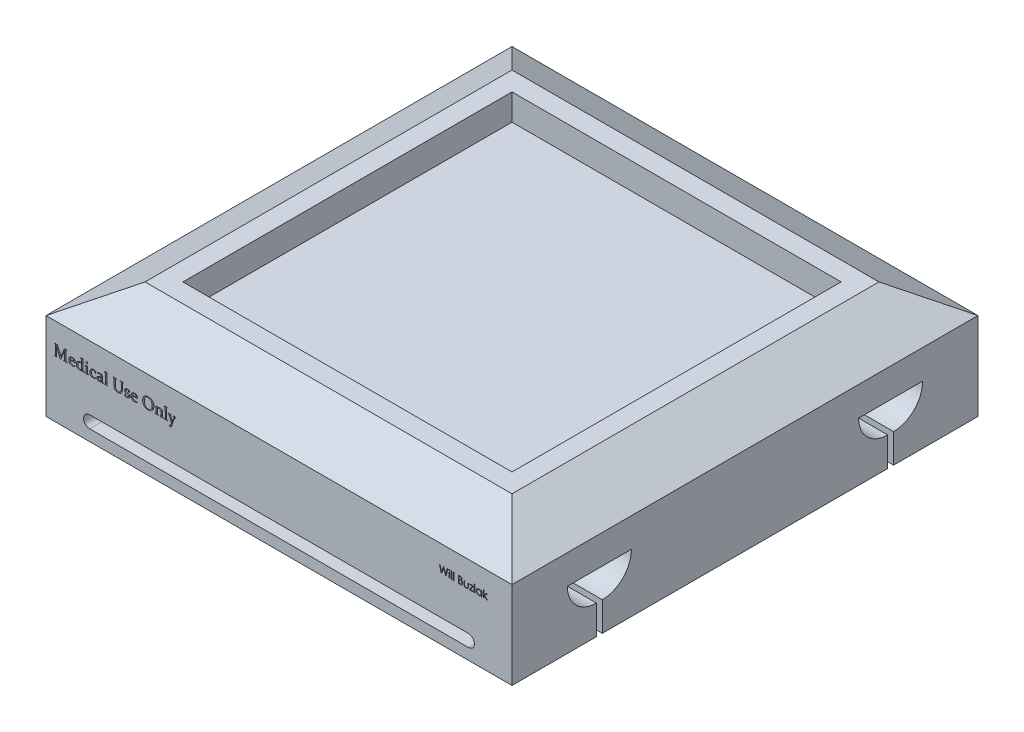
from build123d import *

# Parameters (mm, degrees)
SKETCH3_W           = 143.51
SKETCH3_H           = 143.51
CUT_EXTRUDE1_DEPTH  = 11.43
SKETCH1_3_W         = 203.2
SKETCH1_3_H         = 203.2
BOSS_EXTRUDE1_DEPTH = 38.1
SKETCH8_W           = 0.284935897
SKETCH8_H           = 2.320192308
SKETCH8_H_2         = 3.256410257
SKETCH8_W_2         = 0.284935898
CUT_EXTRUDE3_DEPTH  = 2.54
CUT_EXTRUDE4_DEPTH  = 231.357135919
CUT_EXTRUDE6_DEPTH  = 231.357135919


with BuildPart() as part:
    # Sketch1 → Loft2 section 0
    with BuildSketch(Plane(origin=(0, 0, 0), x_dir=(1, 0, 0), z_dir=(0, 1, 0))):
        with BuildLine():
            Line((-101.6, -101.6), (101.6, -101.6))
            Line((101.6, -101.6), (101.6, 101.6))
            Line((101.6, 101.6), (-101.6, 101.6))
            Line((-101.6, 101.6), (-101.6, -101.6))
        make_face()
    # Sketch2 → Loft2 section 1
    with BuildSketch(Plane(origin=(0, 12.7, 0), x_dir=(1, 0, 0), z_dir=(0, 1, 0))):
        with BuildLine():
            Line((-80.01, -80.01), (80.01, -80.01))
            Line((80.01, -80.01), (80.01, 80.01))
            Line((80.01, 80.01), (-80.01, 80.01))
            Line((-80.01, 80.01), (-80.01, -80.01))
        make_face()
    loft()

    # Sketch3 → Cut-Extrude1 (cut)
    with BuildSketch(Plane(origin=(0, 12.7, 0), x_dir=(1, 0, 0), z_dir=(0, 1, 0))):
        Rectangle(SKETCH3_W, SKETCH3_H)
    extrude(amount=-CUT_EXTRUDE1_DEPTH, mode=Mode.SUBTRACT)

    # Sketch1<3> → Boss-Extrude1 (add)
    with BuildSketch(Plane(origin=(0, 0, 0), x_dir=(1, 0, 0), z_dir=(0, 1, 0))):
        Rectangle(SKETCH1_3_W, SKETCH1_3_H)
    extrude(amount=-BOSS_EXTRUDE1_DEPTH)

    # Sketch8 → Cut-Extrude3 (cut)
    # profile 1 of 27: a face of its own
    with BuildSketch(Plane.XY.offset(101.6)):
        with BuildLine():
            add(Edge.make_bspline(
                [(-93.566932366, -8.50617052), (-93.516270054, -8.508313795), (-93.417282317, -8.512501481), (-93.272537481, -8.516005035), (-93.135116218, -8.519530348), (-93.046020212, -8.519899485), (-93.002636061, -8.520079232)],
                knots=[0, 0, 0, 0, 1.077896715, 2.106073556, 3.077776937, 4, 4, 4, 4], degree=3))
            add(Edge.make_bspline(
                [(-93.002636061, -8.520079232), (-92.958259017, -8.519871259), (-92.86187993, -8.519419579), (-92.706576174, -8.515882014), (-92.529386791, -8.512317337), (-92.404226739, -8.508297576), (-92.337998335, -8.50617052)],
                knots=[0, 0, 0, 0, 0.801017799, 1.739668912, 2.803946475, 4, 4, 4, 4], degree=3))
            Line((-92.337998335, -8.50617052), (-92.324089623, -8.633335885))
            Line((-92.324089623, -8.633335885), (-92.747311852, -8.767455605))
            add(Edge.make_bspline(
                [(-92.747311852, -8.767455605), (-92.759063189, -8.772297959), (-92.781964966, -8.781735055), (-92.807725387, -8.809150963), (-92.823200941, -8.84422491), (-92.826187752, -8.869948107), (-92.827783684, -8.883692696)],
                knots=[0, 0, 0, 0, 1.000840432, 1.950503539, 2.904899519, 4, 4, 4, 4], degree=3))
            add(Edge.make_bspline(
                [(-92.827783684, -8.883692696), (-92.828976629, -8.92375999), (-92.83151003, -9.00884898), (-92.8312476, -9.143993672), (-92.834466306, -9.293658551), (-92.833992138, -9.398313112), (-92.833744561, -9.452956399)],
                knots=[0, 0, 0, 0, 0.844856939, 1.794182144, 2.84827629, 4, 4, 4, 4], degree=3))
            Line((-92.833744561, -9.452956399), (-92.833744561, -12.23271179))
            add(Edge.make_bspline(
                [(-92.833744561, -12.23271179), (-92.833988233, -12.297289525), (-92.834456846, -12.421481156), (-92.831250368, -12.599629125), (-92.831487305, -12.762254183), (-92.828977959, -12.865229529), (-92.827783684, -12.914238666)],
                knots=[0, 0, 0, 0, 1.136952353, 2.186511614, 3.136905056, 4, 4, 4, 4], degree=3))
            add(Edge.make_bspline(
                [(-92.827783684, -12.914238666), (-92.82646821, -12.926811538), (-92.823912221, -12.951240839), (-92.802962629, -12.982571322), (-92.772269211, -13.006599614), (-92.747032625, -13.015652035), (-92.73340314, -13.020540963)],
                knots=[0, 0, 0, 0, 0.980359161, 1.904854316, 2.86847781, 4, 4, 4, 4], degree=3))
            Line((-92.73340314, -13.020540963), (-92.331043979, -13.147706327))
            Line((-92.331043979, -13.147706327), (-92.324089623, -13.274871692))
            add(Edge.make_bspline(
                [(-92.324089623, -13.274871692), (-92.467475961, -13.271721345), (-92.74594855, -13.265603013), (-93.024487409, -13.26515448), (-93.159605808, -13.264936898)],
                knots=[0, 0, 0, 0, 1.029805762, 2, 2, 2, 2], degree=3))
            add(Edge.make_bspline(
                [(-93.159605808, -13.264936898), (-93.288433397, -13.265100311), (-93.545783011, -13.265426751), (-93.803055701, -13.271725871), (-93.93153931, -13.274871692)],
                knots=[0, 0, 0, 0, 1.001187351, 2, 2, 2, 2], degree=3))
            Line((-93.93153931, -13.274871692), (-93.945448022, -13.147706327))
            Line((-93.945448022, -13.147706327), (-93.55997801, -13.028488798))
            add(Edge.make_bspline(
                [(-93.55997801, -13.028488798), (-93.547612927, -13.023651447), (-93.524045185, -13.014431498), (-93.495806885, -12.987520507), (-93.479906996, -12.950443687), (-93.477059875, -12.92300171), (-93.47553226, -12.908277789)],
                knots=[0, 0, 0, 0, 1.002074624, 1.909945489, 2.878586741, 4, 4, 4, 4], degree=3))
            add(Edge.make_bspline(
                [(-93.47553226, -12.908277789), (-93.474453946, -12.860592289), (-93.472170185, -12.759599204), (-93.470365249, -12.599972334), (-93.469340609, -12.423461256), (-93.469492017, -12.300268556), (-93.469571384, -12.235692228)],
                knots=[0, 0, 0, 0, 0.850938587, 1.802202191, 2.847937316, 4, 4, 4, 4], degree=3))
            Line((-93.469571384, -12.235692228), (-93.469571384, -9.278104022))
            Line((-93.469571384, -9.278104022), (-95.122721123, -13.274871692))
            Line((-95.122721123, -13.274871692), (-95.366123579, -13.301695636))
            Line((-95.366123579, -13.301695636), (-97.030201592, -9.278104022))
            Line((-97.030201592, -9.278104022), (-97.030201592, -12.235692228))
            add(Edge.make_bspline(
                [(-97.030201592, -12.235692228), (-97.030411988, -12.300269667), (-97.030813371, -12.423467291), (-97.028096993, -12.599966839), (-97.026676153, -12.75959977), (-97.024346988, -12.860592471), (-97.023247236, -12.908277789)],
                knots=[0, 0, 0, 0, 1.152048264, 2.197820366, 3.149072064, 4, 4, 4, 4], degree=3))
            add(Edge.make_bspline(
                [(-97.023247236, -12.908277789), (-97.021704696, -12.922986291), (-97.01882976, -12.95039953), (-97.00301708, -12.987893185), (-96.973575387, -13.014408778), (-96.949474599, -13.02363978), (-96.936814527, -13.028488798)],
                knots=[0, 0, 0, 0, 1.110001283, 2.068785231, 2.98553869, 4, 4, 4, 4], degree=3))
            Line((-96.936814527, -13.028488798), (-96.56127931, -13.147706327))
            Line((-96.56127931, -13.147706327), (-96.554324954, -13.274871692))
            add(Edge.make_bspline(
                [(-96.554324954, -13.274871692), (-96.617909633, -13.273666618), (-96.739451659, -13.271363121), (-96.913607998, -13.266183567), (-97.07126823, -13.266158435), (-97.170945329, -13.265328452), (-97.217969201, -13.264936898)],
                knots=[0, 0, 0, 0, 1.149788214, 2.197818574, 3.1497992, 4, 4, 4, 4], degree=3))
            add(Edge.make_bspline(
                [(-97.217969201, -13.264936898), (-97.264330838, -13.265326139), (-97.364670304, -13.266168565), (-97.525971669, -13.266210761), (-97.70940106, -13.271432801), (-97.838891663, -13.273681325), (-97.907443912, -13.274871692)],
                knots=[0, 0, 0, 0, 0.806833825, 1.746212635, 2.806846289, 4, 4, 4, 4], degree=3))
            Line((-97.907443912, -13.274871692), (-97.921352624, -13.127836739))
            Line((-97.921352624, -13.127836739), (-97.508065189, -13.001664854))
            add(Edge.make_bspline(
                [(-97.508065189, -13.001664854), (-97.495120903, -12.996720611), (-97.470909542, -12.987472758), (-97.441298978, -12.963642773), (-97.421910551, -12.932354073), (-97.419097983, -12.908542408), (-97.417658562, -12.896356037)],
                knots=[0, 0, 0, 0, 1.113644535, 2.08299243, 3.0189109, 4, 4, 4, 4], degree=3))
            add(Edge.make_bspline(
                [(-97.417658562, -12.896356037), (-97.416580294, -12.847677024), (-97.414299221, -12.744696722), (-97.41250258, -12.582751895), (-97.411466394, -12.404916309), (-97.411618281, -12.28139245), (-97.411697686, -12.21681612)],
                knots=[0, 0, 0, 0, 0.859770789, 1.818842475, 2.859725162, 4, 4, 4, 4], degree=3))
            Line((-97.411697686, -12.21681612), (-97.411697686, -9.448982481))
            add(Edge.make_bspline(
                [(-97.411697686, -9.448982481), (-97.411619884, -9.394672087), (-97.411470919, -9.290686447), (-97.412481459, -9.14199211), (-97.414300424, -9.007532044), (-97.416580675, -8.922767759), (-97.417658562, -8.882699217)],
                knots=[0, 0, 0, 0, 1.150765485, 2.203318281, 3.150698694, 4, 4, 4, 4], degree=3))
            add(Edge.make_bspline(
                [(-97.417658562, -8.882699217), (-97.419254495, -8.868954628), (-97.422241305, -8.84323143), (-97.43771686, -8.808157484), (-97.463477281, -8.780741576), (-97.486379058, -8.771304479), (-97.498130395, -8.766462126)],
                knots=[0, 0, 0, 0, 1.095100481, 2.049496461, 2.999159568, 4, 4, 4, 4], degree=3))
            Line((-97.498130395, -8.766462126), (-97.914398268, -8.633335885))
            Line((-97.914398268, -8.633335885), (-97.921352624, -8.50617052))
            add(Edge.make_bspline(
                [(-97.921352624, -8.50617052), (-97.853137219, -8.50830064), (-97.72400299, -8.512333033), (-97.541845778, -8.515849073), (-97.382568678, -8.519425768), (-97.284202788, -8.519872965), (-97.238832268, -8.520079232)],
                knots=[0, 0, 0, 0, 1.199642463, 2.270966611, 3.202496477, 4, 4, 4, 4], degree=3))
            add(Edge.make_bspline(
                [(-97.238832268, -8.520079232), (-97.141791896, -8.519208996), (-96.943691938, -8.517432481), (-96.745723879, -8.509974942), (-96.644731581, -8.50617052)],
                knots=[0, 0, 0, 0, 0.979711189, 2, 2, 2, 2], degree=3))
            Line((-96.644731581, -8.50617052), (-95.104838494, -12.234698749))
            Line((-95.104838494, -12.234698749), (-93.566932366, -8.50617052))
        make_face()
    # profile 2 of 27: a face of its own
    with BuildSketch(Plane.XY.offset(101.6)):
        with BuildLine():
            add(Edge.make_bspline(
                [(-88.884663903, -12.969873513), (-88.932272678, -12.996199787), (-89.026108358, -13.048088201), (-89.173009824, -13.111032031), (-89.320373585, -13.165853738), (-89.470150511, -13.205286164), (-89.61715169, -13.236051978), (-89.759803074, -13.257634498), (-89.897016114, -13.272961349), (-89.987055231, -13.274243795), (-90.031139143, -13.274871692)],
                knots=[0, 0, 0, 0, 1.088001339, 2.144422862, 3.194694652, 4.231605134, 5.24017467, 6.198986877, 7.118208754, 8, 8, 8, 8], degree=3))
            add(Edge.make_bspline(
                [(-90.031139143, -13.274871692), (-90.091121169, -13.273391424), (-90.208735722, -13.27048887), (-90.380708948, -13.252037816), (-90.543850507, -13.218914947), (-90.69853173, -13.173249963), (-90.845056173, -13.114690521), (-90.982896986, -13.042873565), (-91.111732129, -12.957989844), (-91.231012273, -12.86057206), (-91.339289683, -12.751936649), (-91.4334098, -12.631918599), (-91.512256452, -12.501605122), (-91.577264198, -12.361374692), (-91.627887052, -12.211128927), (-91.663272037, -12.050577156), (-91.685797001, -11.880336922), (-91.688084368, -11.763200837), (-91.68925628, -11.703187264)],
                knots=[0, 0, 0, 0, 1.11582643, 2.187945857, 3.212426872, 4.208416068, 5.184177975, 6.143031594, 7.094694949, 8.049105734, 9.003059163, 9.942077802, 10.879174893, 11.830020455, 12.81183053, 13.822100345, 14.88417357, 16, 16, 16, 16], degree=3))
            add(Edge.make_bspline(
                [(-91.68925628, -11.703187264), (-91.687882471, -11.643193371), (-91.685187817, -11.525518451), (-91.665185822, -11.353286542), (-91.631724135, -11.189570344), (-91.583608558, -11.034705297), (-91.522824349, -10.888010681), (-91.449414112, -10.749084597), (-91.36106544, -10.619195397), (-91.260376255, -10.498559724), (-91.148182894, -10.389367637), (-91.026523212, -10.292920298), (-90.894806465, -10.212527633), (-90.754228271, -10.146304211), (-90.605009434, -10.094717712), (-90.446557954, -10.057944501), (-90.279152203, -10.035718163), (-90.164334897, -10.033360123), (-90.105650099, -10.032154895)],
                knots=[0, 0, 0, 0, 1.111318548, 2.179793863, 3.207377932, 4.202903984, 5.179360803, 6.145489581, 7.108633191, 8.084280136, 9.051810512, 10.004264421, 10.954443161, 11.904047302, 12.87807248, 13.873674151, 14.913203886, 16, 16, 16, 16], degree=3))
            add(Edge.make_bspline(
                [(-90.105650099, -10.032154895), (-90.056596084, -10.032983693), (-89.9611933, -10.034595582), (-89.822187688, -10.050698552), (-89.691709768, -10.077766672), (-89.568569291, -10.113494531), (-89.45525368, -10.163473663), (-89.34841466, -10.220226318), (-89.252075967, -10.291049099), (-89.162962565, -10.370109844), (-89.085031463, -10.460029772), (-89.015524076, -10.557129085), (-88.956598925, -10.662527752), (-88.910237813, -10.776960894), (-88.873254885, -10.898994482), (-88.846766258, -11.029003624), (-88.83043342, -11.167284019), (-88.828849918, -11.262035439), (-88.828035576, -11.310762897)],
                knots=[0, 0, 0, 0, 1.14734647, 2.231418753, 3.267730308, 4.26290843, 5.224306454, 6.160491281, 7.087299362, 8.014495988, 8.942339827, 9.864635339, 10.804563832, 11.759948753, 12.747709896, 13.784021451, 14.860397002, 16, 16, 16, 16], degree=3))
            add(Edge.make_bspline(
                [(-88.828035576, -11.310762897), (-88.82821401, -11.341255644), (-88.828573439, -11.402679108), (-88.834823206, -11.463785525), (-88.837970371, -11.494556588)],
                knots=[0, 0, 0, 0, 0.992869668, 2, 2, 2, 2], degree=3))
            Line((-88.837970371, -11.494556588), (-90.989846774, -11.494556588))
            add(Edge.make_bspline(
                [(-90.989846774, -11.494556588), (-90.989035247, -11.555194221), (-90.987471206, -11.672059964), (-90.971606549, -11.840469201), (-90.944842782, -11.995227796), (-90.908581424, -12.137126877), (-90.86133267, -12.266040748), (-90.802160971, -12.381162428), (-90.7338449, -12.483856351), (-90.652986806, -12.572344176), (-90.561013532, -12.649094936), (-90.457048878, -12.714317703), (-90.341800779, -12.770226823), (-90.215001834, -12.81608512), (-90.075631605, -12.850067032), (-89.92499307, -12.876025087), (-89.762196306, -12.890684468), (-89.650002869, -12.892458683), (-89.592021243, -12.893375598)],
                knots=[0, 0, 0, 0, 1.269712588, 2.447092647, 3.538319353, 4.556077442, 5.510717376, 6.407172453, 7.261281849, 8.086138379, 8.908454141, 9.762760639, 10.649910962, 11.586748376, 12.580907573, 13.650450494, 14.785751622, 16, 16, 16, 16], degree=3))
            add(Edge.make_bspline(
                [(-89.592021243, -12.893375598), (-89.537363162, -12.892508117), (-89.426289503, -12.89074526), (-89.256908717, -12.879399039), (-89.082184538, -12.860841604), (-88.964402638, -12.842232472), (-88.904533491, -12.832773354)],
                knots=[0, 0, 0, 0, 0.949332871, 1.92919096, 2.947397083, 4, 4, 4, 4], degree=3))
            Line((-88.904533491, -12.832773354), (-88.884663903, -12.969873513))
        make_face()
        with BuildLine():
            Line((-89.527445082, -11.240225859), (-89.527445082, -11.142864876))
            add(Edge.make_bspline(
                [(-89.527445082, -11.142864876), (-89.527596597, -11.105755885), (-89.527887849, -11.034422547), (-89.536516524, -10.931345836), (-89.548181464, -10.836530326), (-89.563082102, -10.749486427), (-89.585826985, -10.671466117), (-89.610691243, -10.600787194), (-89.641761654, -10.538416475), (-89.677825005, -10.484005193), (-89.718778682, -10.437118008), (-89.764122747, -10.396630083), (-89.814084817, -10.362938615), (-89.868325848, -10.334670968), (-89.927443284, -10.312925409), (-89.991325892, -10.296849688), (-90.060040631, -10.28817628), (-90.10728339, -10.287058261), (-90.131480563, -10.286485624)],
                knots=[0, 0, 0, 0, 1.485080919, 2.854719931, 4.13734814, 5.310097045, 6.384530283, 7.386943904, 8.305931308, 9.166344468, 9.993215283, 10.791424739, 11.593039963, 12.399464484, 13.234268364, 14.108864001, 15.031382865, 16, 16, 16, 16], degree=3))
            add(Edge.make_bspline(
                [(-90.131480563, -10.286485624), (-90.163658419, -10.287044915), (-90.226680607, -10.288140317), (-90.317873133, -10.302616066), (-90.403298303, -10.32470727), (-90.483488991, -10.353601878), (-90.556405506, -10.394669043), (-90.624686558, -10.44215278), (-90.686716132, -10.499407806), (-90.760427119, -10.587441798), (-90.837957066, -10.711179051), (-90.909198588, -10.874165339), (-90.957843377, -11.051966252), (-90.970454778, -11.176347902), (-90.976931542, -11.240225859)],
                knots=[0, 0, 0, 0, 0.814762289, 1.595758966, 2.33262623, 3.049679912, 3.748274989, 4.446819654, 5.153633779, 5.880056007, 7.351494699, 8.835919903, 10.375041896, 12, 12, 12, 12], degree=3))
            Line((-90.976931542, -11.240225859), (-89.527445082, -11.240225859))
        make_face(mode=Mode.SUBTRACT)
    # profile 3 of 27: a face of its own
    with BuildSketch(Plane.XY.offset(101.6)):
        with BuildLine():
            add(Edge.make_bspline(
                [(-86.513228549, -8.442587838), (-86.415129965, -8.422403108), (-86.222282278, -8.382722836), (-85.93976386, -8.318404147), (-85.667824499, -8.255692682), (-85.491185982, -8.210455837), (-85.404505527, -8.188257109)],
                knots=[0, 0, 0, 0, 1.056402051, 2.076734283, 3.056210661, 4, 4, 4, 4], degree=3))
            Line((-85.404505527, -8.188257109), (-85.374701145, -8.215081053))
            add(Edge.make_bspline(
                [(-85.374701145, -8.215081053), (-85.377931015, -8.334955691), (-85.38451506, -8.579318388), (-85.389820746, -8.952562849), (-85.394327001, -9.339026483), (-85.394488605, -9.600983304), (-85.394570733, -9.734111072)],
                knots=[0, 0, 0, 0, 0.947204375, 1.930862259, 2.94845384, 4, 4, 4, 4], degree=3))
            Line((-85.394570733, -9.734111072), (-85.394570733, -11.530321847))
            add(Edge.make_bspline(
                [(-85.394570733, -11.530321847), (-85.394324664, -11.681330999), (-85.393835221, -11.981694611), (-85.39233585, -12.282054877), (-85.391590294, -12.431407672)],
                knots=[0, 0, 0, 0, 1.005508965, 2, 2, 2, 2], degree=3))
            add(Edge.make_bspline(
                [(-85.391590294, -12.431407672), (-85.391309436, -12.458231019), (-85.39077885, -12.50890472), (-85.389261688, -12.580820989), (-85.384905552, -12.644387593), (-85.380629966, -12.700203892), (-85.373011929, -12.749314097), (-85.360423884, -12.791855292), (-85.343065691, -12.828506221), (-85.315436062, -12.871030298), (-85.260790766, -12.910873139), (-85.193360396, -12.933304443), (-85.128202506, -12.943901116), (-85.067883309, -12.951018673), (-84.997860951, -12.954241731), (-84.948166676, -12.95601366), (-84.921674533, -12.956958281)],
                knots=[0, 0, 0, 0, 1.305907314, 2.467073085, 3.500835633, 4.407207651, 5.191693457, 5.91588729, 6.55770083, 7.161327261, 8.367395539, 9.754371013, 10.589250188, 11.579089997, 12.709406786, 14, 14, 14, 14], degree=3))
            Line((-84.921674533, -12.956958281), (-84.904785383, -13.095051919))
            add(Edge.make_bspline(
                [(-84.904785383, -13.095051919), (-84.958932622, -13.115381338), (-85.075840571, -13.159274081), (-85.226162563, -13.206522294), (-85.348217581, -13.240045799), (-85.426249558, -13.259246815), (-85.488271839, -13.271298466), (-85.524353855, -13.273809411), (-85.539618727, -13.274871692)],
                knots=[0, 0, 0, 0, 1.573418711, 3.39712902, 4.284552925, 5.016636446, 5.583977834, 6, 6, 6, 6], degree=3))
            add(Edge.make_bspline(
                [(-85.539618727, -13.274871692), (-85.566887279, -13.273829406), (-85.61973643, -13.271809354), (-85.695657264, -13.253163932), (-85.765029003, -13.223652031), (-85.826756873, -13.180701942), (-85.881508844, -13.126027403), (-85.927390704, -13.0582466), (-85.969263494, -12.980465723), (-85.988554778, -12.922555422), (-85.998606214, -12.892382119)],
                knots=[0, 0, 0, 0, 1.010627886, 1.958696816, 2.883532348, 3.79387784, 4.732577557, 5.738560232, 6.82171037, 8, 8, 8, 8], degree=3))
            add(Edge.make_bspline(
                [(-85.998606214, -12.892382119), (-86.041596554, -12.922782536), (-86.125593932, -12.98218089), (-86.255493833, -13.059361468), (-86.383249048, -13.126780292), (-86.511282296, -13.18072848), (-86.638247192, -13.222503449), (-86.764460777, -13.252710136), (-86.889532404, -13.271284093), (-86.972818318, -13.273685805), (-87.013942172, -13.274871692)],
                knots=[0, 0, 0, 0, 1.144988251, 2.237154038, 3.284344094, 4.285160498, 5.255648446, 6.188730786, 7.105654634, 8, 8, 8, 8], degree=3))
            add(Edge.make_bspline(
                [(-87.013942172, -13.274871692), (-87.064689235, -13.273623449), (-87.163980904, -13.271181137), (-87.308697248, -13.249513308), (-87.44601755, -13.216019718), (-87.575606545, -13.168524615), (-87.69704951, -13.105991779), (-87.810514812, -13.03051378), (-87.915853378, -12.940833876), (-88.012340022, -12.838952565), (-88.099580451, -12.727170777), (-88.174902382, -12.607271424), (-88.240306924, -12.482139071), (-88.291623982, -12.349892922), (-88.332582782, -12.212025047), (-88.362653359, -12.067898227), (-88.379366042, -11.916851212), (-88.381744133, -11.814165437), (-88.3829568, -11.761802549)],
                knots=[0, 0, 0, 0, 1.063975209, 2.081773179, 3.062358038, 4.025037854, 4.969524334, 5.92131467, 6.877505962, 7.865152182, 8.860100696, 9.846842557, 10.831748708, 11.817316108, 12.817392758, 13.846014782, 14.901611386, 16, 16, 16, 16], degree=3))
            add(Edge.make_bspline(
                [(-88.3829568, -11.761802549), (-88.381419359, -11.694844939), (-88.378426393, -11.564497323), (-88.355554015, -11.374848554), (-88.316830734, -11.197245897), (-88.263329757, -11.030823765), (-88.193474765, -10.876324851), (-88.108849944, -10.73283256), (-88.007331376, -10.602091403), (-87.892028017, -10.482484114), (-87.762288636, -10.375926759), (-87.619720322, -10.283213797), (-87.464273799, -10.205413878), (-87.296728821, -10.142003947), (-87.117093069, -10.092484751), (-86.925710538, -10.056819092), (-86.721995913, -10.035916025), (-86.582159423, -10.033432206), (-86.510248111, -10.032154895)],
                knots=[0, 0, 0, 0, 1.10935951, 2.15961062, 3.159570005, 4.117494101, 5.050785583, 5.963671667, 6.87139717, 7.787280164, 8.711232335, 9.647310657, 10.599511988, 11.586055612, 12.611219577, 13.683194932, 14.808576411, 16, 16, 16, 16], degree=3))
            add(Edge.make_bspline(
                [(-86.510248111, -10.032154895), (-86.473469785, -10.032741648), (-86.397494536, -10.033953739), (-86.280574833, -10.043864847), (-86.15709248, -10.056905424), (-86.073379636, -10.07140412), (-86.030397556, -10.078848427)],
                knots=[0, 0, 0, 0, 0.914184146, 1.888486392, 2.915850394, 4, 4, 4, 4], degree=3))
            add(Edge.make_bspline(
                [(-86.030397556, -10.078848427), (-86.03077876, -9.845374994), (-86.031530392, -9.38502937), (-86.039423049, -8.924751062), (-86.043312788, -8.697912046)],
                knots=[0, 0, 0, 0, 1.014339752, 2, 2, 2, 2], degree=3))
            Line((-86.043312788, -8.697912046), (-86.496339399, -8.569753202))
            Line((-86.496339399, -8.569753202), (-86.513228549, -8.442587838))
        make_face()
        with BuildLine():
            add(Edge.make_bspline(
                [(-86.030397556, -10.388814004), (-86.067979322, -10.377826628), (-86.14468379, -10.35540137), (-86.265617198, -10.334830853), (-86.39263948, -10.319843524), (-86.479732682, -10.31880612), (-86.524156823, -10.318276965)],
                knots=[0, 0, 0, 0, 0.937716541, 1.913881535, 2.935921318, 4, 4, 4, 4], degree=3))
            add(Edge.make_bspline(
                [(-86.524156823, -10.318276965), (-86.569914245, -10.319055767), (-86.659073254, -10.320573274), (-86.788219931, -10.337363646), (-86.909553571, -10.361396574), (-87.02260961, -10.397213101), (-87.126856806, -10.444226853), (-87.223640452, -10.499673382), (-87.310466638, -10.567244819), (-87.389388354, -10.643965012), (-87.459829301, -10.730947471), (-87.519093746, -10.829808299), (-87.571416369, -10.937775792), (-87.611227375, -11.057667886), (-87.644489784, -11.186653951), (-87.66658749, -11.326708784), (-87.680752711, -11.477043533), (-87.682595348, -11.580954489), (-87.683547295, -11.634637185)],
                knots=[0, 0, 0, 0, 1.093537697, 2.130774261, 3.109210272, 4.048370446, 4.959364127, 5.839477137, 6.709052925, 7.582657879, 8.466929347, 9.376889881, 10.333253432, 11.329977176, 12.392096499, 13.515616736, 14.716512718, 16, 16, 16, 16], degree=3))
            add(Edge.make_bspline(
                [(-87.683547295, -11.634637185), (-87.682935428, -11.681037641), (-87.681735408, -11.772040271), (-87.667932969, -11.904665305), (-87.649033345, -12.030400459), (-87.619998796, -12.14875579), (-87.581871079, -12.259706854), (-87.537957745, -12.364845421), (-87.483485108, -12.461541575), (-87.422384255, -12.551309083), (-87.352920431, -12.631462366), (-87.276981549, -12.702475911), (-87.192688632, -12.760617069), (-87.103054773, -12.810465643), (-87.005356991, -12.846834802), (-86.901790729, -12.873359732), (-86.791358247, -12.89133597), (-86.715310244, -12.892682419), (-86.676159173, -12.893375598)],
                knots=[0, 0, 0, 0, 1.222691988, 2.397997703, 3.51174248, 4.572530401, 5.60502943, 6.602309399, 7.57149132, 8.525575593, 9.460169825, 10.362189733, 11.258318317, 12.152914764, 13.059233441, 13.997246336, 14.968941333, 16, 16, 16, 16], degree=3))
            add(Edge.make_bspline(
                [(-86.676159173, -12.893375598), (-86.623659077, -12.891233853), (-86.51668171, -12.886869703), (-86.355852436, -12.851470939), (-86.191208616, -12.798633848), (-86.085115577, -12.746437323), (-86.030397556, -12.719516701)],
                knots=[0, 0, 0, 0, 0.932638166, 1.900399851, 2.917120602, 4, 4, 4, 4], degree=3))
            Line((-86.030397556, -12.719516701), (-86.030397556, -10.388814004))
        make_face(mode=Mode.SUBTRACT)
    # profile 4 of 27: a face of its own
    with BuildSketch(Plane.XY.offset(101.6)):
        with BuildLine():
            add(Edge.make_bspline(
                [(-83.430461938, -8.870777464), (-83.431725055, -8.898728332), (-83.434184173, -8.953144876), (-83.455376318, -9.030697163), (-83.490933093, -9.1000612), (-83.539948149, -9.159690659), (-83.599389726, -9.208392518), (-83.667865589, -9.244284062), (-83.744806739, -9.265522118), (-83.798907364, -9.267922482), (-83.826860222, -9.269162708)],
                knots=[0, 0, 0, 0, 1.063200754, 2.069907435, 3.034566934, 4.011680512, 4.988794089, 5.94225601, 6.936799246, 8, 8, 8, 8], degree=3))
            add(Edge.make_bspline(
                [(-83.826860222, -9.269162708), (-83.853502173, -9.268284765), (-83.905280195, -9.266578505), (-83.978642587, -9.245673362), (-84.044876499, -9.213793183), (-84.101810832, -9.168686527), (-84.148166602, -9.112567819), (-84.180904852, -9.046902864), (-84.201723334, -8.973355082), (-84.204124629, -8.92159284), (-84.205375878, -8.89462097)],
                knots=[0, 0, 0, 0, 1.065430781, 2.070640393, 3.032818583, 3.997285388, 4.959738498, 5.927855834, 6.92026308, 8, 8, 8, 8], degree=3))
            add(Edge.make_bspline(
                [(-84.205375878, -8.89462097), (-84.204228312, -8.865976215), (-84.202032083, -8.811155464), (-84.1801224, -8.734030071), (-84.146597488, -8.665239055), (-84.096572297, -8.608640193), (-84.036491399, -8.562045736), (-83.96617706, -8.52937644), (-83.887150317, -8.510094459), (-83.831941855, -8.507519571), (-83.803016717, -8.50617052)],
                knots=[0, 0, 0, 0, 1.087021019, 2.080356674, 3.026893605, 3.973849637, 4.926320503, 5.901271409, 6.900421917, 8, 8, 8, 8], degree=3))
            add(Edge.make_bspline(
                [(-83.803016717, -8.50617052), (-83.776724938, -8.507167883), (-83.726126305, -8.509087311), (-83.654323109, -8.527953841), (-83.589110427, -8.556362232), (-83.533099061, -8.5988766), (-83.486911514, -8.651681497), (-83.452628967, -8.715601351), (-83.434648701, -8.790341506), (-83.431897123, -8.843204736), (-83.430461938, -8.870777464)],
                knots=[0, 0, 0, 0, 1.069114253, 2.057514666, 3.005670275, 3.950266259, 4.897268861, 5.845040291, 6.876002869, 8, 8, 8, 8], degree=3))
        make_face()
    # profile 5 of 27: a face of its own
    with BuildSketch(Plane.XY.offset(101.6)):
        with BuildLine():
            add(Edge.make_bspline(
                [(-84.535211042, -10.286485624), (-84.438418731, -10.266713948), (-84.247797321, -10.227775889), (-83.968116193, -10.162950174), (-83.697006412, -10.10058812), (-83.520439276, -10.054743252), (-83.433442376, -10.032154895)],
                knots=[0, 0, 0, 0, 1.048239641, 2.064388324, 3.046299219, 4, 4, 4, 4], degree=3))
            Line((-83.433442376, -10.032154895), (-83.402644514, -10.055998401))
            add(Edge.make_bspline(
                [(-83.402644514, -10.055998401), (-83.405772924, -10.130172578), (-83.412182179, -10.282135166), (-83.419173341, -10.51594162), (-83.423168446, -10.760691978), (-83.423393055, -10.927609525), (-83.423507582, -11.012719074)],
                knots=[0, 0, 0, 0, 0.93086781, 1.907093381, 2.932848343, 4, 4, 4, 4], degree=3))
            Line((-83.423507582, -11.012719074), (-83.423507582, -12.297287952))
            add(Edge.make_bspline(
                [(-83.423507582, -12.297287952), (-83.423750072, -12.359216708), (-83.424193573, -12.47248106), (-83.421476281, -12.627121269), (-83.420257224, -12.750671049), (-83.417661027, -12.822841282), (-83.416553226, -12.853636422)],
                knots=[0, 0, 0, 0, 1.335529992, 2.442612241, 3.335460455, 4, 4, 4, 4], degree=3))
            add(Edge.make_bspline(
                [(-83.416553226, -12.853636422), (-83.414666817, -12.86742036), (-83.411063797, -12.893747532), (-83.393815564, -12.928481312), (-83.367298045, -12.955877008), (-83.344206108, -12.965061469), (-83.332107476, -12.969873513)],
                knots=[0, 0, 0, 0, 1.084652955, 2.071675361, 2.989686804, 4, 4, 4, 4], degree=3))
            Line((-83.332107476, -12.969873513), (-82.943657026, -13.084123645))
            Line((-82.943657026, -13.084123645), (-82.93670267, -13.21128901))
            add(Edge.make_bspline(
                [(-82.93670267, -13.21128901), (-83.011215122, -13.21007334), (-83.154943102, -13.207728419), (-83.36288391, -13.202575529), (-83.554980415, -13.202572918), (-83.677839028, -13.201747848), (-83.736453596, -13.201354216)],
                knots=[0, 0, 0, 0, 1.11807904, 2.156676318, 3.120569412, 4, 4, 4, 4], degree=3))
            add(Edge.make_bspline(
                [(-83.736453596, -13.201354216), (-83.794736991, -13.20174776), (-83.91627096, -13.20256839), (-84.106049639, -13.202579084), (-84.31067865, -13.20771884), (-84.452088445, -13.210071415), (-84.525276248, -13.21128901)],
                knots=[0, 0, 0, 0, 0.886574316, 1.848706599, 2.886580391, 4, 4, 4, 4], degree=3))
            Line((-84.525276248, -13.21128901), (-84.53918496, -13.084123645))
            Line((-84.53918496, -13.084123645), (-84.149741031, -12.971860472))
            add(Edge.make_bspline(
                [(-84.149741031, -12.971860472), (-84.13776674, -12.966888005), (-84.115544129, -12.957659802), (-84.088786821, -12.934183268), (-84.070681965, -12.904373768), (-84.067782138, -12.881375788), (-84.06628876, -12.869532092)],
                knots=[0, 0, 0, 0, 1.09977499, 2.041028644, 2.991152283, 4, 4, 4, 4], degree=3))
            add(Edge.make_bspline(
                [(-84.06628876, -12.869532092), (-84.065182821, -12.844367258), (-84.062651613, -12.786771531), (-84.061361064, -12.68937937), (-84.058668144, -12.570175588), (-84.059100233, -12.483402024), (-84.059334405, -12.436375069)],
                knots=[0, 0, 0, 0, 0.697636688, 1.596707974, 2.697535261, 4, 4, 4, 4], degree=3))
            Line((-84.059334405, -12.436375069), (-84.059334405, -11.332619444))
            add(Edge.make_bspline(
                [(-84.059334405, -11.332619444), (-84.059607245, -11.261750971), (-84.06014146, -11.122991984), (-84.061913043, -10.918986186), (-84.06575555, -10.723253084), (-84.070114841, -10.595453476), (-84.072249637, -10.532868518)],
                knots=[0, 0, 0, 0, 1.063170299, 2.081665177, 3.060569063, 4, 4, 4, 4], degree=3))
            Line((-84.072249637, -10.532868518), (-84.518321892, -10.413650989))
            Line((-84.518321892, -10.413650989), (-84.535211042, -10.286485624))
        make_face()
    # profile 6 of 27: a face of its own
    with BuildSketch(Plane.XY.offset(101.6)):
        with BuildLine():
            add(Edge.make_bspline(
                [(-79.805255568, -12.918212584), (-79.841611289, -12.943034199), (-79.916296035, -12.99402469), (-80.039658648, -13.060199861), (-80.174946208, -13.120482891), (-80.320086484, -13.174542165), (-80.471328402, -13.219206111), (-80.624596241, -13.250411582), (-80.776932565, -13.271910099), (-80.878472537, -13.273889195), (-80.928880781, -13.274871692)],
                knots=[0, 0, 0, 0, 0.882738831, 1.813390673, 2.80377232, 3.852861252, 4.918899001, 5.964003516, 6.989255112, 8, 8, 8, 8], degree=3))
            add(Edge.make_bspline(
                [(-80.928880781, -13.274871692), (-80.987876041, -13.273422407), (-81.103192996, -13.270589516), (-81.27179169, -13.251796188), (-81.431333683, -13.219581231), (-81.581496689, -13.171711909), (-81.723798797, -13.113972435), (-81.857183429, -13.041866299), (-81.980809464, -12.955857489), (-82.09486567, -12.857519998), (-82.198263082, -12.748725749), (-82.287856832, -12.629881128), (-82.364567323, -12.502654695), (-82.425442732, -12.365819245), (-82.475204194, -12.221132894), (-82.507894228, -12.066962197), (-82.529708115, -11.904494576), (-82.532117453, -11.793007162), (-82.53335003, -11.735972085)],
                knots=[0, 0, 0, 0, 1.129439273, 2.207694272, 3.24348846, 4.240120636, 5.220916596, 6.179806805, 7.136577593, 8.098669517, 9.058460634, 10.004435623, 10.942816066, 11.896240791, 12.866653306, 13.866567363, 14.908571903, 16, 16, 16, 16], degree=3))
            add(Edge.make_bspline(
                [(-82.53335003, -11.735972085), (-82.531780754, -11.674308657), (-82.528698613, -11.553198364), (-82.505769236, -11.3761169), (-82.466947633, -11.207677512), (-82.412288621, -11.048542019), (-82.342465311, -10.898074914), (-82.256073031, -10.757100888), (-82.154749924, -10.624660777), (-82.038026386, -10.503063885), (-81.911186926, -10.391745524), (-81.772837241, -10.296417337), (-81.627465069, -10.214269178), (-81.473332005, -10.147340559), (-81.310840595, -10.095620772), (-81.140083524, -10.059498675), (-80.961690078, -10.03539459), (-80.839880189, -10.033247757), (-80.777871911, -10.032154895)],
                knots=[0, 0, 0, 0, 1.077947374, 2.117146722, 3.115743743, 4.095360098, 5.053786042, 6.010058354, 6.980528855, 7.963442125, 8.952594341, 9.92594507, 10.895499699, 11.867902792, 12.858545155, 13.871557981, 14.916499917, 16, 16, 16, 16], degree=3))
            add(Edge.make_bspline(
                [(-80.777871911, -10.032154895), (-80.696253066, -10.034684473), (-80.533144593, -10.039739625), (-80.291225121, -10.079233371), (-80.052255041, -10.140777885), (-79.899369736, -10.20260252), (-79.822144718, -10.233831216)],
                knots=[0, 0, 0, 0, 0.99554525, 1.98951436, 2.98446885, 4, 4, 4, 4], degree=3))
            add(Edge.make_bspline(
                [(-79.822144718, -10.233831216), (-79.857955083, -10.385610958), (-79.930218555, -10.691894662), (-79.989794301, -11.000897811), (-80.01984712, -11.156773588)],
                knots=[0, 0, 0, 0, 0.991105574, 2, 2, 2, 2], degree=3))
            Line((-80.01984712, -11.156773588), (-80.150986402, -11.176643176))
            Line((-80.150986402, -11.176643176), (-80.422206282, -10.342120471))
            add(Edge.make_bspline(
                [(-80.422206282, -10.342120471), (-80.448528398, -10.333198378), (-80.502073342, -10.315048888), (-80.587662528, -10.299417537), (-80.677524846, -10.287528494), (-80.739412656, -10.286837424), (-80.770917555, -10.286485624)],
                knots=[0, 0, 0, 0, 0.938558852, 1.909234068, 2.93566489, 4, 4, 4, 4], degree=3))
            add(Edge.make_bspline(
                [(-80.770917555, -10.286485624), (-80.811357629, -10.287790903), (-80.890566108, -10.290347504), (-81.006061868, -10.305600574), (-81.114274842, -10.334354089), (-81.216542243, -10.37141067), (-81.311436693, -10.421717317), (-81.399537503, -10.483052639), (-81.48142136, -10.554524329), (-81.554758385, -10.637503026), (-81.619931587, -10.729134309), (-81.678227508, -10.827377247), (-81.725477557, -10.933785883), (-81.765540739, -11.04624402), (-81.796425366, -11.166284411), (-81.817410028, -11.293308213), (-81.832419376, -11.427307095), (-81.833424605, -11.519017858), (-81.833940524, -11.566087105)],
                knots=[0, 0, 0, 0, 1.034482433, 2.026202523, 2.971108288, 3.89296035, 4.802159824, 5.70898953, 6.633172841, 7.574923145, 8.533843906, 9.505581803, 10.491062316, 11.506263186, 12.555922716, 13.655866539, 14.796906751, 16, 16, 16, 16], degree=3))
            add(Edge.make_bspline(
                [(-81.833940524, -11.566087105), (-81.833052731, -11.620764894), (-81.83133279, -11.726693267), (-81.816259327, -11.880109474), (-81.791840006, -12.022714013), (-81.757186741, -12.154462651), (-81.712908676, -12.275260887), (-81.657592995, -12.384735055), (-81.593332664, -12.483659976), (-81.517950243, -12.571376178), (-81.430972843, -12.647650221), (-81.333433153, -12.714367452), (-81.223730975, -12.770718909), (-81.101785023, -12.814349554), (-80.969304051, -12.850320879), (-80.825084069, -12.876111119), (-80.669224766, -12.890660655), (-80.561324297, -12.892451634), (-80.505658552, -12.893375598)],
                knots=[0, 0, 0, 0, 1.210463526, 2.345055215, 3.409546088, 4.410919899, 5.357558355, 6.252818009, 7.121249117, 7.963529517, 8.805107403, 9.67561022, 10.574197041, 11.527711793, 12.538066235, 13.611059688, 14.767548057, 16, 16, 16, 16], degree=3))
            add(Edge.make_bspline(
                [(-80.505658552, -12.893375598), (-80.451592956, -12.891798053), (-80.341305243, -12.888580039), (-80.173529002, -12.863082045), (-79.999981641, -12.823742774), (-79.884456787, -12.785731955), (-79.825125156, -12.766210234)],
                knots=[0, 0, 0, 0, 0.932615954, 1.902431272, 2.922723797, 4, 4, 4, 4], degree=3))
            Line((-79.825125156, -12.766210234), (-79.805255568, -12.918212584))
        make_face()
    # profile 7 of 27: a face of its own
    with BuildSketch(Plane.XY.offset(101.6)):
        with BuildLine():
            add(Edge.make_bspline(
                [(-79.135650445, -10.316290007), (-79.082189126, -10.293636836), (-78.977400895, -10.249234907), (-78.82076056, -10.192054507), (-78.668959838, -10.143077463), (-78.522397246, -10.101814787), (-78.379692736, -10.070818081), (-78.24196796, -10.049506406), (-78.109074045, -10.034020338), (-78.022002211, -10.032769294), (-77.97924041, -10.032154895)],
                knots=[0, 0, 0, 0, 1.162191366, 2.277983058, 3.336719423, 4.354825681, 5.32485196, 6.257811028, 7.144394516, 8, 8, 8, 8], degree=3))
            add(Edge.make_bspline(
                [(-77.97924041, -10.032154895), (-77.93747799, -10.032796334), (-77.855729267, -10.034051932), (-77.736516221, -10.047403642), (-77.623598031, -10.068194183), (-77.516922218, -10.096513691), (-77.41726051, -10.134562736), (-77.324332197, -10.180286601), (-77.237984377, -10.234397736), (-77.158593576, -10.296871244), (-77.086874297, -10.367188527), (-77.024623778, -10.445684767), (-76.971807821, -10.531330905), (-76.928967321, -10.624432836), (-76.895890627, -10.724736445), (-76.873690359, -10.832765789), (-76.859223284, -10.948078905), (-76.858151797, -11.027574866), (-76.857602156, -11.068353921)],
                knots=[0, 0, 0, 0, 1.154864505, 2.260613687, 3.313528327, 4.329116645, 5.309127034, 6.259619705, 7.189898684, 8.122745197, 9.049091587, 9.961885299, 10.887325284, 11.825956599, 12.790646977, 13.802219542, 14.872604248, 16, 16, 16, 16], degree=3))
            Line((-76.857602156, -11.068353921), (-76.874491306, -12.454257699))
            add(Edge.make_bspline(
                [(-76.874491306, -12.454257699), (-76.87514401, -12.481085235), (-76.876385129, -12.532097904), (-76.873189875, -12.604591974), (-76.872491562, -12.66896133), (-76.867226913, -12.725340277), (-76.860197613, -12.774547122), (-76.847041294, -12.817429337), (-76.829135532, -12.85413975), (-76.807351485, -12.88651093), (-76.777885572, -12.911149347), (-76.745008935, -12.934108626), (-76.704452368, -12.950276211), (-76.658094534, -12.96308579), (-76.604574319, -12.97304192), (-76.543106847, -12.979370714), (-76.473526092, -12.984425504), (-76.42445459, -12.985956484), (-76.398614668, -12.986762663)],
                knots=[0, 0, 0, 0, 1.471020648, 2.797151709, 3.978069045, 4.999038863, 5.900628928, 6.699021675, 7.446208378, 8.136503142, 8.818144844, 9.538364578, 10.327618293, 11.195666327, 12.175094329, 13.308128108, 14.582522269, 16, 16, 16, 16], degree=3))
            Line((-76.398614668, -12.986762663), (-76.381725518, -13.10995411))
            add(Edge.make_bspline(
                [(-76.381725518, -13.10995411), (-76.407208352, -13.118939511), (-76.460343651, -13.137675339), (-76.544059494, -13.166172839), (-76.63646377, -13.192377183), (-76.732894544, -13.217919889), (-76.824326819, -13.241721934), (-76.903864787, -13.256617122), (-76.965811378, -13.269721636), (-77.002277524, -13.271250746), (-77.017552341, -13.271891254)],
                knots=[0, 0, 0, 0, 0.985902152, 2.055744909, 3.225828889, 4.489028549, 5.696386243, 6.670295183, 7.44301771, 8, 8, 8, 8], degree=3))
            add(Edge.make_bspline(
                [(-77.017552341, -13.271891254), (-77.044142552, -13.271122293), (-77.095523922, -13.269636397), (-77.169148315, -13.252917406), (-77.23648809, -13.227410307), (-77.297038205, -13.19072695), (-77.351750283, -13.14466639), (-77.398192082, -13.086707408), (-77.439929009, -13.019667748), (-77.460093715, -12.969260376), (-77.470578952, -12.943049569)],
                knots=[0, 0, 0, 0, 1.059598829, 2.047506807, 2.997542817, 3.922508474, 4.860232882, 5.836844012, 6.875202903, 8, 8, 8, 8], degree=3))
            add(Edge.make_bspline(
                [(-77.470578952, -12.943049569), (-77.50969979, -12.9693355), (-77.586028, -13.020621673), (-77.702826456, -13.088235788), (-77.817433024, -13.146610587), (-77.931657075, -13.19174881), (-78.042714787, -13.229579133), (-78.152886198, -13.255130266), (-78.261185611, -13.272159782), (-78.333188472, -13.273976225), (-78.368684339, -13.274871692)],
                knots=[0, 0, 0, 0, 1.163287242, 2.269676174, 3.330006226, 4.335059418, 5.299417817, 6.223531767, 7.124239209, 8, 8, 8, 8], degree=3))
            add(Edge.make_bspline(
                [(-78.368684339, -13.274871692), (-78.407113952, -13.273942001), (-78.482443723, -13.272119619), (-78.592464716, -13.262787226), (-78.696699906, -13.244598409), (-78.794859248, -13.219641207), (-78.888108185, -13.189476607), (-78.974856811, -13.149979373), (-79.056522583, -13.104900611), (-79.130932319, -13.051679173), (-79.199393573, -12.993917563), (-79.256689773, -12.927208916), (-79.307157149, -12.856519273), (-79.348396207, -12.779549944), (-79.378483868, -12.696292081), (-79.402287546, -12.608063007), (-79.414477872, -12.513540426), (-79.416675842, -12.448655946), (-79.417798597, -12.415512002)],
                knots=[0, 0, 0, 0, 1.204398007, 2.360862418, 3.456070366, 4.515599374, 5.532821235, 6.522139286, 7.497758003, 8.450709485, 9.384889346, 10.296611781, 11.197702386, 12.102906084, 13.022272891, 13.966084909, 14.961046329, 16, 16, 16, 16], degree=3))
            add(Edge.make_bspline(
                [(-79.417798597, -12.415512002), (-79.41663361, -12.37466891), (-79.414361447, -12.295009511), (-79.391740416, -12.180084934), (-79.356194889, -12.073030718), (-79.304604456, -11.974919981), (-79.239737456, -11.884251143), (-79.158752257, -11.80360198), (-79.064659752, -11.730283056), (-78.954967476, -11.666940146), (-78.830348647, -11.611143764), (-78.68986122, -11.563107312), (-78.533255368, -11.521315581), (-78.360244632, -11.488088335), (-78.170801678, -11.462792154), (-77.965320845, -11.443969426), (-77.743235847, -11.433340471), (-77.589807694, -11.431781561), (-77.510318129, -11.430973906)],
                knots=[0, 0, 0, 0, 0.81417712, 1.587951787, 2.327764538, 3.057861449, 3.791538751, 4.543907719, 5.33044608, 6.165778307, 7.064941022, 8.051421975, 9.125462046, 10.297111319, 11.564453426, 12.938190922, 14.413707864, 16, 16, 16, 16], degree=3))
            Line((-77.510318129, -11.430973906), (-77.506344211, -11.164721423))
            add(Edge.make_bspline(
                [(-77.506344211, -11.164721423), (-77.506454266, -11.133897538), (-77.506667802, -11.074091227), (-77.516062734, -10.98741621), (-77.530513812, -10.9069061), (-77.551447452, -10.832682409), (-77.57828392, -10.764700908), (-77.611074837, -10.702358113), (-77.650810831, -10.646483528), (-77.69755431, -10.59746383), (-77.749027627, -10.552889285), (-77.808693923, -10.516563078), (-77.873557407, -10.484745988), (-77.944708456, -10.457158943), (-78.023280032, -10.438087773), (-78.108027932, -10.424536686), (-78.198923554, -10.41512563), (-78.261694449, -10.414153822), (-78.294173384, -10.413650989)],
                knots=[0, 0, 0, 0, 1.178877807, 2.287327935, 3.33130839, 4.306154863, 5.233377577, 6.123482079, 6.995632284, 7.847379035, 8.710644625, 9.593229153, 10.51140048, 11.474061412, 12.506828002, 13.59856155, 14.757447031, 16, 16, 16, 16], degree=3))
            add(Edge.make_bspline(
                [(-78.294173384, -10.413650989), (-78.348224499, -10.415378454), (-78.463404829, -10.4190596), (-78.6452242, -10.44491407), (-78.84654745, -10.484670905), (-78.985825368, -10.521451876), (-79.05915253, -10.540816354)],
                knots=[0, 0, 0, 0, 0.83408085, 1.77738621, 2.829836321, 4, 4, 4, 4], degree=3))
            Line((-79.05915253, -10.540816354), (-79.135650445, -10.316290007))
        make_face()
        with BuildLine():
            add(Edge.make_bspline(
                [(-77.510318129, -11.685304635), (-77.566294248, -11.685544428), (-77.673658142, -11.686004359), (-77.827702322, -11.693362632), (-77.96764552, -11.703534509), (-78.093994505, -11.719436578), (-78.206498809, -11.739813533), (-78.305471024, -11.764506004), (-78.390745388, -11.792579486), (-78.462791542, -11.82677001), (-78.52383953, -11.866301465), (-78.576500763, -11.911340657), (-78.620389841, -11.963566982), (-78.65652652, -12.021785162), (-78.684475025, -12.08606808), (-78.704193779, -12.15624413), (-78.716361379, -12.232620579), (-78.717696078, -12.285649473), (-78.718389092, -12.313183622)],
                knots=[0, 0, 0, 0, 1.735040219, 3.327859706, 4.779734428, 6.083611171, 7.273601935, 8.321819161, 9.243799248, 10.051932879, 10.786564842, 11.492519957, 12.191800465, 12.892586422, 13.609723774, 14.357084664, 15.14695042, 16, 16, 16, 16], degree=3))
            add(Edge.make_bspline(
                [(-78.718389092, -12.313183622), (-78.717800175, -12.338709589), (-78.716665209, -12.387903468), (-78.708503763, -12.458625644), (-78.696352002, -12.523809554), (-78.676546064, -12.582541764), (-78.654825266, -12.637312386), (-78.624161883, -12.684525854), (-78.590509011, -12.727558518), (-78.53615797, -12.775257597), (-78.45692581, -12.824105542), (-78.347454706, -12.864408385), (-78.223793326, -12.889719447), (-78.136343335, -12.892118326), (-78.090510104, -12.893375598)],
                knots=[0, 0, 0, 0, 0.935175583, 1.802279075, 2.606736545, 3.358968438, 4.071276197, 4.758217004, 5.414006548, 6.067095506, 7.397239938, 8.799189378, 10.322429894, 12, 12, 12, 12], degree=3))
            add(Edge.make_bspline(
                [(-78.090510104, -12.893375598), (-78.037432909, -12.891859955), (-77.934077094, -12.888908582), (-77.784414304, -12.865727553), (-77.644326246, -12.827992436), (-77.55854628, -12.788600621), (-77.516279005, -12.769190672)],
                knots=[0, 0, 0, 0, 1.074164754, 2.09169251, 3.059699337, 4, 4, 4, 4], degree=3))
            Line((-77.516279005, -12.769190672), (-77.510318129, -11.685304635))
        make_face(mode=Mode.SUBTRACT)
    # profile 8 of 27: a face of its own
    with BuildSketch(Plane.XY.offset(101.6)):
        with BuildLine():
            Line((-76.132362186, -8.569753202), (-76.149251336, -8.442587838))
            add(Edge.make_bspline(
                [(-76.149251336, -8.442587838), (-76.051480932, -8.422414995), (-75.859288241, -8.382760121), (-75.577172586, -8.31813647), (-75.304837666, -8.255716634), (-75.12753825, -8.210464605), (-75.040528313, -8.188257109)],
                knots=[0, 0, 0, 0, 1.052993297, 2.069927162, 3.052814047, 4, 4, 4, 4], degree=3))
            Line((-75.040528313, -8.188257109), (-75.010723931, -8.215081053))
            add(Edge.make_bspline(
                [(-75.010723931, -8.215081053), (-75.012469771, -8.262433963), (-75.016131824, -8.361760843), (-75.020006615, -8.517416594), (-75.02262475, -8.686321544), (-75.026036762, -8.868449513), (-75.027528667, -9.063844744), (-75.02989652, -9.272469435), (-75.03078427, -9.494019535), (-75.030658292, -9.646022586), (-75.030593519, -9.724176278)],
                knots=[0, 0, 0, 0, 0.753482469, 1.580495519, 2.47583624, 3.439623635, 4.477057472, 5.582944572, 6.757249903, 8, 8, 8, 8], degree=3))
            Line((-75.030593519, -9.724176278), (-75.030593519, -11.893935311))
            add(Edge.make_bspline(
                [(-75.030593519, -11.893935311), (-75.030850221, -11.988648202), (-75.031336704, -12.168141652), (-75.028102699, -12.422791902), (-75.028379779, -12.648331015), (-75.025823592, -12.789062095), (-75.024632643, -12.854629901)],
                knots=[0, 0, 0, 0, 1.183000277, 2.24194193, 3.180905806, 4, 4, 4, 4], degree=3))
            add(Edge.make_bspline(
                [(-75.024632643, -12.854629901), (-75.022230264, -12.869497676), (-75.017754187, -12.897199091), (-74.997471182, -12.932995758), (-74.968639151, -12.961085459), (-74.943368132, -12.969486938), (-74.930252099, -12.973847431)],
                knots=[0, 0, 0, 0, 1.103824245, 2.056628817, 2.99136159, 4, 4, 4, 4], degree=3))
            Line((-74.930252099, -12.973847431), (-74.564651676, -13.084123645))
            Line((-74.564651676, -13.084123645), (-74.554716881, -13.21128901))
            add(Edge.make_bspline(
                [(-74.554716881, -13.21128901), (-74.627904732, -13.210073915), (-74.768983569, -13.207731666), (-74.973612062, -13.20256254), (-75.163391064, -13.202573989), (-75.285256152, -13.201748849), (-75.343539534, -13.201354216)],
                knots=[0, 0, 0, 0, 1.113419363, 2.146256607, 3.113425881, 4, 4, 4, 4], degree=3))
            add(Edge.make_bspline(
                [(-75.343539534, -13.201354216), (-75.40182292, -13.201748213), (-75.523356873, -13.202569787), (-75.712804574, -13.202572725), (-75.916440122, -13.207707435), (-76.056856295, -13.210069167), (-76.129381748, -13.21128901)],
                knots=[0, 0, 0, 0, 0.88993587, 1.855716195, 2.892469798, 4, 4, 4, 4], degree=3))
            Line((-76.129381748, -13.21128901), (-76.14229698, -13.084123645))
            Line((-76.14229698, -13.084123645), (-75.763781324, -12.97484091))
            add(Edge.make_bspline(
                [(-75.763781324, -12.97484091), (-75.750674003, -12.970451876), (-75.726082639, -12.962217368), (-75.698604169, -12.936507257), (-75.678314427, -12.906069658), (-75.675077082, -12.882124072), (-75.673374698, -12.869532092)],
                knots=[0, 0, 0, 0, 1.104332378, 2.071898381, 2.986092257, 4, 4, 4, 4], degree=3))
            add(Edge.make_bspline(
                [(-75.673374698, -12.869532092), (-75.672278593, -12.805288315), (-75.670029964, -12.673494055), (-75.668562306, -12.470483415), (-75.665840504, -12.256892384), (-75.666223878, -12.110845947), (-75.666420342, -12.036002867)],
                knots=[0, 0, 0, 0, 0.924974555, 1.897558672, 2.922581138, 4, 4, 4, 4], degree=3))
            Line((-75.666420342, -12.036002867), (-75.666420342, -10.676923033))
            add(Edge.make_bspline(
                [(-75.666420342, -10.676923033), (-75.666328426, -10.576912627), (-75.666149159, -10.381858642), (-75.667418905, -10.09706203), (-75.668463722, -9.827167496), (-75.669037664, -9.572831854), (-75.67148444, -9.333408641), (-75.672984252, -9.109535465), (-75.67629646, -8.900580718), (-75.678347857, -8.766462128), (-75.679335574, -8.701885964)],
                knots=[0, 0, 0, 0, 1.21525066, 2.370148199, 3.460662011, 4.494840104, 5.460635751, 6.370097352, 7.215225426, 8, 8, 8, 8], degree=3))
            Line((-75.679335574, -8.701885964), (-76.132362186, -8.569753202))
        make_face()
    # profile 9 of 27: a face of its own
    with BuildSketch(Plane.XY.offset(101.6)):
        with BuildLine():
            add(Edge.make_bspline(
                [(-72.488279707, -8.50617052), (-72.347876969, -8.510063132), (-72.074389843, -8.517645458), (-71.800800058, -8.518614296), (-71.667665714, -8.519085753)],
                knots=[0, 0, 0, 0, 1.026759394, 2, 2, 2, 2], degree=3))
            add(Edge.make_bspline(
                [(-71.667665714, -8.519085753), (-71.533868927, -8.518621893), (-71.259947652, -8.517672236), (-70.986129815, -8.510063018), (-70.846058241, -8.50617052)],
                knots=[0, 0, 0, 0, 0.976899564, 2, 2, 2, 2], degree=3))
            Line((-70.846058241, -8.50617052), (-70.833143009, -8.633335885))
            Line((-70.833143009, -8.633335885), (-71.248417402, -8.757520811))
            add(Edge.make_bspline(
                [(-71.248417402, -8.757520811), (-71.260770719, -8.761311032), (-71.284016551, -8.768443273), (-71.311881323, -8.792512463), (-71.330565268, -8.824295486), (-71.334037866, -8.848993412), (-71.33584359, -8.861836149)],
                knots=[0, 0, 0, 0, 1.048455193, 1.972928674, 2.945938055, 4, 4, 4, 4], degree=3))
            add(Edge.make_bspline(
                [(-71.33584359, -8.861836149), (-71.33691582, -8.90256708), (-71.339164667, -8.987994303), (-71.341058652, -9.12179122), (-71.341790631, -9.267507015), (-71.342452767, -9.368510746), (-71.342797946, -9.421165058)],
                knots=[0, 0, 0, 0, 0.874059781, 1.833213707, 2.87043143, 4, 4, 4, 4], degree=3))
            Line((-71.342797946, -9.421165058), (-71.342797946, -11.256121529))
            add(Edge.make_bspline(
                [(-71.342797946, -11.256121529), (-71.341820346, -11.332970517), (-71.339939275, -11.480841108), (-71.326382945, -11.693458375), (-71.302922674, -11.887923813), (-71.269854942, -12.064092437), (-71.226315858, -12.221631854), (-71.174205027, -12.361264383), (-71.111502952, -12.482359145), (-71.039588613, -12.587159474), (-70.954684202, -12.674995893), (-70.859841277, -12.751347703), (-70.752327935, -12.814647119), (-70.633985422, -12.868113522), (-70.503373165, -12.908162616), (-70.361621063, -12.936760232), (-70.208318734, -12.95361232), (-70.102316681, -12.955815048), (-70.047300795, -12.956958281)],
                knots=[0, 0, 0, 0, 1.487367103, 2.861948614, 4.121246947, 5.276483138, 6.327731883, 7.281230477, 8.155615152, 8.961107962, 9.731804593, 10.511589598, 11.310732991, 12.139850824, 13.019668838, 13.948615318, 14.935315477, 16, 16, 16, 16], degree=3))
            add(Edge.make_bspline(
                [(-70.047300795, -12.956958281), (-69.991613207, -12.955898596), (-69.883905796, -12.95384902), (-69.728654512, -12.935795446), (-69.584989681, -12.906572193), (-69.453623291, -12.863575995), (-69.33324265, -12.8101302), (-69.224494054, -12.7443153), (-69.128918409, -12.664988358), (-69.043291736, -12.574316273), (-68.970936337, -12.468043771), (-68.906597783, -12.347756335), (-68.853626173, -12.210799514), (-68.810214984, -12.058109685), (-68.776660874, -11.889309878), (-68.753838274, -11.704679026), (-68.73835835, -11.504090022), (-68.736745898, -11.365105049), (-68.735907972, -11.292880267)],
                knots=[0, 0, 0, 0, 1.090911602, 2.109972219, 3.058155407, 3.959058634, 4.812998463, 5.634360711, 6.441161075, 7.240067254, 8.069947598, 8.952503839, 9.908119361, 10.94123665, 12.059916882, 13.276948929, 14.584942213, 16, 16, 16, 16], degree=3))
            Line((-68.735907972, -11.292880267), (-68.735907972, -9.413217222))
            add(Edge.make_bspline(
                [(-68.735907972, -9.413217222), (-68.735673506, -9.360229194), (-68.73522507, -9.258885053), (-68.73828703, -9.112866261), (-68.738598109, -8.978653668), (-68.743496362, -8.892953981), (-68.745842766, -8.851901355)],
                knots=[0, 0, 0, 0, 1.13239545, 2.165803245, 3.121366752, 4, 4, 4, 4], degree=3))
            add(Edge.make_bspline(
                [(-68.745842766, -8.851901355), (-68.747391192, -8.839783405), (-68.750338022, -8.816721575), (-68.767519705, -8.78492535), (-68.79703278, -8.762118143), (-68.820730042, -8.752614612), (-68.833268955, -8.747586017)],
                knots=[0, 0, 0, 0, 0.999644608, 1.902436811, 2.890118151, 4, 4, 4, 4], degree=3))
            Line((-68.833268955, -8.747586017), (-69.225693322, -8.633335885))
            Line((-69.225693322, -8.633335885), (-69.231654198, -8.50617052))
            add(Edge.make_bspline(
                [(-69.231654198, -8.50617052), (-69.16343841, -8.508269231), (-69.031986951, -8.512313435), (-68.842224645, -8.516353408), (-68.667692435, -8.518191892), (-68.556419603, -8.518797415), (-68.50343379, -8.519085753)],
                knots=[0, 0, 0, 0, 1.12440359, 2.166719702, 3.127029974, 4, 4, 4, 4], degree=3))
            add(Edge.make_bspline(
                [(-68.50343379, -8.519085753), (-68.452434944, -8.518795896), (-68.344804829, -8.51818417), (-68.175570735, -8.516354489), (-67.990114477, -8.512276975), (-67.861311856, -8.508264592), (-67.794089491, -8.50617052)],
                knots=[0, 0, 0, 0, 0.862586181, 1.820438229, 2.862482011, 4, 4, 4, 4], degree=3))
            Line((-67.794089491, -8.50617052), (-67.781174259, -8.633335885))
            Line((-67.781174259, -8.633335885), (-68.203403008, -8.764475167))
            add(Edge.make_bspline(
                [(-68.203403008, -8.764475167), (-68.215100855, -8.769747649), (-68.237549237, -8.779865638), (-68.263899541, -8.806393256), (-68.28056666, -8.840642549), (-68.282736723, -8.866275333), (-68.28387484, -8.879718779)],
                knots=[0, 0, 0, 0, 1.019445305, 1.956334173, 2.928172929, 4, 4, 4, 4], degree=3))
            add(Edge.make_bspline(
                [(-68.28387484, -8.879718779), (-68.284949377, -8.919124979), (-68.28722462, -9.002564392), (-68.289100734, -9.134706398), (-68.289835512, -9.282077944), (-68.29048547, -9.385399881), (-68.290829196, -9.440041166)],
                knots=[0, 0, 0, 0, 0.844151059, 1.787420975, 2.829888724, 4, 4, 4, 4], degree=3))
            Line((-68.290829196, -9.440041166), (-68.290829196, -11.171675779))
            add(Edge.make_bspline(
                [(-68.290829196, -11.171675779), (-68.292087257, -11.260799202), (-68.294527556, -11.433674759), (-68.315436261, -11.683907267), (-68.34981215, -11.916309055), (-68.397633125, -12.130994978), (-68.461683944, -12.327190728), (-68.537063934, -12.506631827), (-68.629726645, -12.666542866), (-68.733940046, -12.810385558), (-68.854617703, -12.936495641), (-68.992177024, -13.043811862), (-69.144496941, -13.136457571), (-69.313697973, -13.210717983), (-69.498818862, -13.267977726), (-69.699381852, -13.309431666), (-69.915856033, -13.334484134), (-70.065445154, -13.337102545), (-70.142674818, -13.338454374)],
                knots=[0, 0, 0, 0, 1.303440465, 2.528325198, 3.669607772, 4.737742902, 5.741077709, 6.6849478, 7.578952388, 8.438298064, 9.277629393, 10.12264418, 10.983272156, 11.87887625, 12.817998893, 13.812643605, 14.870714672, 16, 16, 16, 16], degree=3))
            add(Edge.make_bspline(
                [(-70.142674818, -13.338454374), (-70.218556751, -13.336835088), (-70.365351044, -13.333702565), (-70.57815483, -13.312322066), (-70.775099576, -13.274395833), (-70.957675438, -13.223620229), (-71.124145798, -13.155352267), (-71.276877264, -13.074464095), (-71.412594791, -12.976169223), (-71.533905679, -12.863468746), (-71.639695459, -12.734401221), (-71.730366457, -12.588358258), (-71.808194781, -12.427004387), (-71.870077549, -12.248372915), (-71.920144837, -12.054120997), (-71.953744484, -11.842898825), (-71.975034306, -11.615538232), (-71.977401097, -11.458511569), (-71.978624769, -11.377326017)],
                knots=[0, 0, 0, 0, 1.176589698, 2.276123506, 3.311371269, 4.283303519, 5.209180383, 6.096003033, 6.956754695, 7.799615279, 8.6569447, 9.535973254, 10.459212225, 11.428767893, 12.462448151, 13.565764221, 14.741457213, 16, 16, 16, 16], degree=3))
            Line((-71.978624769, -11.377326017), (-71.978624769, -9.440041166))
            add(Edge.make_bspline(
                [(-71.978624769, -9.440041166), (-71.978408917, -9.385398222), (-71.978000742, -9.282068877), (-71.980721277, -9.134713149), (-71.982151946, -9.002563683), (-71.984479761, -8.919124751), (-71.985579125, -8.879718779)],
                knots=[0, 0, 0, 0, 1.170074907, 2.212601756, 3.155859676, 4, 4, 4, 4], degree=3))
            add(Edge.make_bspline(
                [(-71.985579125, -8.879718779), (-71.986717243, -8.866275333), (-71.988887306, -8.840642549), (-72.005554424, -8.806393256), (-72.031904728, -8.779865638), (-72.05435311, -8.769747649), (-72.066050957, -8.764475167)],
                knots=[0, 0, 0, 0, 1.071827071, 2.043665827, 2.980554695, 4, 4, 4, 4], degree=3))
            Line((-72.066050957, -8.764475167), (-72.48231883, -8.633335885))
            Line((-72.48231883, -8.633335885), (-72.488279707, -8.50617052))
        make_face()
    # profile 10 of 27: a face of its own
    with BuildSketch(Plane.XY.offset(101.6)):
        with BuildLine():
            add(Edge.make_bspline(
                [(-65.667050072, -10.340133513), (-65.699389508, -10.331663905), (-65.764873204, -10.314513909), (-65.866946348, -10.298136818), (-65.973157361, -10.287897725), (-66.045540757, -10.28696143), (-66.082324466, -10.286485624)],
                knots=[0, 0, 0, 0, 0.954528457, 1.932812062, 2.949498856, 4, 4, 4, 4], degree=3))
            add(Edge.make_bspline(
                [(-66.082324466, -10.286485624), (-66.131425342, -10.287979761), (-66.22556677, -10.29084448), (-66.359464551, -10.313272316), (-66.478761843, -10.351858262), (-66.581253451, -10.406005124), (-66.665616266, -10.473097442), (-66.726636327, -10.554300625), (-66.764570908, -10.647660829), (-66.768694258, -10.714319634), (-66.770805698, -10.74845355)],
                knots=[0, 0, 0, 0, 1.272674125, 2.440106363, 3.507232878, 4.509846496, 5.431178605, 6.277820515, 7.118125033, 8, 8, 8, 8], degree=3))
            add(Edge.make_bspline(
                [(-66.770805698, -10.74845355), (-66.769326433, -10.781371151), (-66.766492513, -10.844433464), (-66.743720659, -10.933688261), (-66.703850164, -11.011637043), (-66.646321871, -11.080295342), (-66.566406319, -11.14111459), (-66.46245566, -11.198704079), (-66.332879439, -11.257251774), (-66.23596281, -11.291361347), (-66.183659366, -11.309769417)],
                knots=[0, 0, 0, 0, 0.895527373, 1.71561797, 2.48581616, 3.260434764, 4.13348477, 5.203736201, 6.490927409, 8, 8, 8, 8], degree=3))
            Line((-66.183659366, -11.309769417), (-65.912439487, -11.405143441))
            add(Edge.make_bspline(
                [(-65.912439487, -11.405143441), (-65.875613009, -11.418198702), (-65.80389437, -11.443623495), (-65.700467065, -11.4838578), (-65.605078226, -11.527143017), (-65.51651122, -11.569860195), (-65.436811779, -11.616317994), (-65.364157086, -11.662527502), (-65.298993278, -11.710527094), (-65.241086246, -11.759905793), (-65.190510475, -11.812476474), (-65.146486979, -11.868110345), (-65.109427251, -11.928106025), (-65.07973153, -11.992323553), (-65.055539979, -12.060047225), (-65.038849647, -12.132033409), (-65.028640059, -12.207908533), (-65.027719567, -12.259833647), (-65.027249332, -12.286359678)],
                knots=[0, 0, 0, 0, 1.390063382, 2.707113407, 3.946409543, 5.116102202, 6.203321651, 7.226208164, 8.178176977, 9.080363566, 9.930263959, 10.769316213, 11.599805213, 12.432547466, 13.282121163, 14.153710905, 15.056820133, 16, 16, 16, 16], degree=3))
            add(Edge.make_bspline(
                [(-65.027249332, -12.286359678), (-65.028418636, -12.323845892), (-65.030707469, -12.397222549), (-65.047874316, -12.503900198), (-65.075721838, -12.604293626), (-65.11487355, -12.698820685), (-65.165454786, -12.787670067), (-65.228744478, -12.869141081), (-65.302424605, -12.944744562), (-65.38624401, -13.013417079), (-65.478943908, -13.074961772), (-65.578035091, -13.128546442), (-65.683705786, -13.173320831), (-65.794446134, -13.211129189), (-65.911745406, -13.240299369), (-66.03485095, -13.259041296), (-66.1638, -13.273132806), (-66.251836591, -13.274282822), (-66.296916019, -13.274871692)],
                knots=[0, 0, 0, 0, 0.996087398, 1.949771861, 2.863880038, 3.759708059, 4.662643715, 5.572886903, 6.494171951, 7.463450336, 8.447327826, 9.447723195, 10.453294589, 11.494377856, 12.555439124, 13.661059676, 14.802337848, 16, 16, 16, 16], degree=3))
            add(Edge.make_bspline(
                [(-66.296916019, -13.274871692), (-66.38183353, -13.272308371), (-66.553848011, -13.267115941), (-66.812738592, -13.226623896), (-67.074430154, -13.161158359), (-67.245848131, -13.098919553), (-67.333115044, -13.067234495)],
                knots=[0, 0, 0, 0, 0.958589248, 1.941781279, 2.95218462, 4, 4, 4, 4], degree=3))
            add(Edge.make_bspline(
                [(-67.333115044, -13.067234495), (-67.297057338, -12.925852996), (-67.226127917, -12.647740238), (-67.173970519, -12.365507646), (-67.148327874, -12.226750914)],
                knots=[0, 0, 0, 0, 1.016720703, 2, 2, 2, 2], degree=3))
            Line((-67.148327874, -12.226750914), (-67.018182071, -12.206881325))
            Line((-67.018182071, -12.206881325), (-66.776766574, -12.946030007))
            add(Edge.make_bspline(
                [(-66.776766574, -12.946030007), (-66.743221843, -12.957796244), (-66.673287597, -12.982326561), (-66.558262962, -13.003767901), (-66.431394442, -13.01782979), (-66.342330501, -13.019612209), (-66.295922539, -13.020540963)],
                knots=[0, 0, 0, 0, 0.870960177, 1.815782687, 2.861884266, 4, 4, 4, 4], degree=3))
            add(Edge.make_bspline(
                [(-66.295922539, -13.020540963), (-66.247089823, -13.019399767), (-66.15363083, -13.017215678), (-66.021764567, -12.990269871), (-65.903886798, -12.95081734), (-65.803736954, -12.891630485), (-65.721128672, -12.81806537), (-65.661748586, -12.72817232), (-65.626851412, -12.6239406), (-65.622579529, -12.550234464), (-65.62035654, -12.511879505)],
                knots=[0, 0, 0, 0, 1.229123253, 2.352370096, 3.379572022, 4.348958536, 5.264957642, 6.144899252, 7.034648711, 8, 8, 8, 8], degree=3))
            add(Edge.make_bspline(
                [(-65.62035654, -12.511879505), (-65.621832601, -12.478297676), (-65.624661997, -12.413926174), (-65.647501366, -12.322800908), (-65.686924252, -12.242901586), (-65.744205973, -12.174310443), (-65.818178881, -12.11435041), (-65.908588036, -12.058558532), (-66.017966772, -12.008255496), (-66.09827858, -11.980310206), (-66.140939751, -11.965465829)],
                knots=[0, 0, 0, 0, 0.983034511, 1.884334826, 2.73046834, 3.571524282, 4.480883454, 5.509361802, 6.676987271, 8, 8, 8, 8], degree=3))
            Line((-66.140939751, -11.965465829), (-66.484683627, -11.849228738))
            add(Edge.make_bspline(
                [(-66.484683627, -11.849228738), (-66.520608642, -11.837068106), (-66.590446856, -11.813427845), (-66.689107014, -11.772179626), (-66.780392827, -11.731282953), (-66.861650033, -11.685861173), (-66.935650952, -11.640802344), (-67.000525929, -11.593010055), (-67.056738725, -11.543393848), (-67.118811455, -11.474350422), (-67.18251157, -11.37989017), (-67.234588444, -11.252997042), (-67.267776743, -11.114080107), (-67.271550301, -11.017223479), (-67.27350628, -10.967019021)],
                knots=[0, 0, 0, 0, 1.062551077, 2.065598835, 2.995756501, 3.863838614, 4.672486954, 5.422389682, 6.119123823, 6.769635327, 8.020605952, 9.289216011, 10.594897995, 12, 12, 12, 12], degree=3))
            add(Edge.make_bspline(
                [(-67.27350628, -10.967019021), (-67.272678338, -10.931850859), (-67.27105256, -10.862793229), (-67.254555491, -10.762205241), (-67.228860886, -10.667199075), (-67.193110195, -10.577799074), (-67.145847943, -10.494961588), (-67.088555688, -10.417516474), (-67.02066403, -10.346030142), (-66.943019905, -10.280441034), (-66.856823331, -10.222310156), (-66.763542881, -10.171505258), (-66.664206195, -10.127165094), (-66.557266041, -10.093374922), (-66.444691469, -10.064604028), (-66.324837169, -10.046830206), (-66.19883117, -10.034211741), (-66.112494273, -10.032850079), (-66.068415754, -10.032154895)],
                knots=[0, 0, 0, 0, 0.983240181, 1.930730308, 2.843328053, 3.732868976, 4.616648846, 5.504305812, 6.421922637, 7.36864228, 8.342627301, 9.32538714, 10.337666878, 11.38077179, 12.45944243, 13.585158923, 14.767124834, 16, 16, 16, 16], degree=3))
            add(Edge.make_bspline(
                [(-66.068415754, -10.032154895), (-65.985862142, -10.033670792), (-65.824238568, -10.036638617), (-65.588128681, -10.065772699), (-65.362780211, -10.109663846), (-65.219927968, -10.156219932), (-65.149447299, -10.179189848)],
                knots=[0, 0, 0, 0, 1.059006029, 2.073323452, 3.049413226, 4, 4, 4, 4], degree=3))
            add(Edge.make_bspline(
                [(-65.149447299, -10.179189848), (-65.18054454, -10.308464835), (-65.244273379, -10.57339331), (-65.295885395, -10.840948716), (-65.322312717, -10.977947294)],
                knots=[0, 0, 0, 0, 0.975923681, 2, 2, 2, 2], degree=3))
            Line((-65.322312717, -10.977947294), (-65.450471561, -11.000797321))
            Line((-65.450471561, -11.000797321), (-65.667050072, -10.340133513))
        make_face()
    # profile 11 of 27: a face of its own
    with BuildSketch(Plane.XY.offset(101.6)):
        with BuildLine():
            add(Edge.make_bspline(
                [(-61.734858564, -12.969873513), (-61.782467339, -12.996199787), (-61.87630302, -13.048088201), (-62.023204485, -13.111032031), (-62.170568246, -13.165853738), (-62.320345172, -13.205286164), (-62.467346352, -13.236051978), (-62.609997736, -13.257634498), (-62.747210776, -13.272961349), (-62.837249892, -13.274243795), (-62.881333804, -13.274871692)],
                knots=[0, 0, 0, 0, 1.088001339, 2.144422862, 3.194694652, 4.231605134, 5.24017467, 6.198986877, 7.118208754, 8, 8, 8, 8], degree=3))
            add(Edge.make_bspline(
                [(-62.881333804, -13.274871692), (-62.941315831, -13.273391424), (-63.058930383, -13.27048887), (-63.23090361, -13.252037816), (-63.394045169, -13.218914947), (-63.548726391, -13.173249963), (-63.695250834, -13.114690521), (-63.833091647, -13.042873565), (-63.96192679, -12.957989844), (-64.081206934, -12.86057206), (-64.189484345, -12.751936649), (-64.283604461, -12.631918599), (-64.362451113, -12.501605122), (-64.427458859, -12.361374692), (-64.478081714, -12.211128927), (-64.513466699, -12.050577156), (-64.535991662, -11.880336922), (-64.53827903, -11.763200837), (-64.539450941, -11.703187264)],
                knots=[0, 0, 0, 0, 1.11582643, 2.187945857, 3.212426872, 4.208416068, 5.184177975, 6.143031594, 7.094694949, 8.049105734, 9.003059163, 9.942077802, 10.879174893, 11.830020455, 12.81183053, 13.822100345, 14.88417357, 16, 16, 16, 16], degree=3))
            add(Edge.make_bspline(
                [(-64.539450941, -11.703187264), (-64.538077133, -11.643193371), (-64.535382478, -11.525518451), (-64.515380483, -11.353286542), (-64.481918796, -11.189570344), (-64.433803219, -11.034705297), (-64.37301901, -10.888010681), (-64.299608773, -10.749084597), (-64.211260102, -10.619195397), (-64.110570916, -10.498559724), (-63.998377555, -10.389367637), (-63.876717873, -10.292920298), (-63.745001126, -10.212527633), (-63.604422933, -10.146304211), (-63.455204095, -10.094717712), (-63.296752616, -10.057944501), (-63.129346865, -10.035718163), (-63.014529558, -10.033360123), (-62.95584476, -10.032154895)],
                knots=[0, 0, 0, 0, 1.111318548, 2.179793863, 3.207377932, 4.202903984, 5.179360803, 6.145489581, 7.108633191, 8.084280136, 9.051810512, 10.004264421, 10.954443161, 11.904047302, 12.87807248, 13.873674151, 14.913203886, 16, 16, 16, 16], degree=3))
            add(Edge.make_bspline(
                [(-62.95584476, -10.032154895), (-62.906790746, -10.032983693), (-62.811387962, -10.034595582), (-62.672382349, -10.050698552), (-62.54190443, -10.077766672), (-62.418763952, -10.113494531), (-62.305448342, -10.163473663), (-62.198609322, -10.220226318), (-62.102270628, -10.291049099), (-62.013157227, -10.370109844), (-61.935226124, -10.460029772), (-61.865718738, -10.557129085), (-61.806793587, -10.662527752), (-61.760432474, -10.776960894), (-61.723449546, -10.898994482), (-61.69696092, -11.029003624), (-61.680628081, -11.167284019), (-61.679044579, -11.262035439), (-61.678230238, -11.310762897)],
                knots=[0, 0, 0, 0, 1.14734647, 2.231418753, 3.267730308, 4.26290843, 5.224306454, 6.160491281, 7.087299362, 8.014495988, 8.942339827, 9.864635339, 10.804563832, 11.759948753, 12.747709896, 13.784021451, 14.860397002, 16, 16, 16, 16], degree=3))
            add(Edge.make_bspline(
                [(-61.678230238, -11.310762897), (-61.678408671, -11.341255644), (-61.6787681, -11.402679108), (-61.685017867, -11.463785525), (-61.688165032, -11.494556588)],
                knots=[0, 0, 0, 0, 0.992869668, 2, 2, 2, 2], degree=3))
            Line((-61.688165032, -11.494556588), (-63.840041436, -11.494556588))
            add(Edge.make_bspline(
                [(-63.840041436, -11.494556588), (-63.839229908, -11.555194221), (-63.837665867, -11.672059964), (-63.82180121, -11.840469201), (-63.795037443, -11.995227796), (-63.758776086, -12.137126877), (-63.711527331, -12.266040748), (-63.652355632, -12.381162428), (-63.584039561, -12.483856351), (-63.503181468, -12.572344176), (-63.411208193, -12.649094936), (-63.307243539, -12.714317703), (-63.19199544, -12.770226823), (-63.065196496, -12.81608512), (-62.925826267, -12.850067032), (-62.775187731, -12.876025087), (-62.612390968, -12.890684468), (-62.50019753, -12.892458683), (-62.442215905, -12.893375598)],
                knots=[0, 0, 0, 0, 1.269712588, 2.447092647, 3.538319353, 4.556077442, 5.510717376, 6.407172453, 7.261281849, 8.086138379, 8.908454141, 9.762760639, 10.649910962, 11.586748376, 12.580907573, 13.650450494, 14.785751622, 16, 16, 16, 16], degree=3))
            add(Edge.make_bspline(
                [(-62.442215905, -12.893375598), (-62.387557824, -12.892508117), (-62.276484164, -12.89074526), (-62.107103378, -12.879399039), (-61.932379199, -12.860841604), (-61.8145973, -12.842232472), (-61.754728153, -12.832773354)],
                knots=[0, 0, 0, 0, 0.949332871, 1.92919096, 2.947397083, 4, 4, 4, 4], degree=3))
            Line((-61.754728153, -12.832773354), (-61.734858564, -12.969873513))
        make_face()
        with BuildLine():
            Line((-62.377639743, -11.240225859), (-62.377639743, -11.142864876))
            add(Edge.make_bspline(
                [(-62.377639743, -11.142864876), (-62.377791258, -11.105755885), (-62.37808251, -11.034422547), (-62.386711186, -10.931345836), (-62.398376125, -10.836530326), (-62.413276764, -10.749486427), (-62.436021647, -10.671466117), (-62.460885904, -10.600787194), (-62.491956315, -10.538416475), (-62.528019667, -10.484005193), (-62.568973343, -10.437118008), (-62.614317409, -10.396630083), (-62.664279478, -10.362938615), (-62.71852051, -10.334670968), (-62.777637945, -10.312925409), (-62.841520554, -10.296849688), (-62.910235293, -10.28817628), (-62.957478052, -10.287058261), (-62.981675225, -10.286485624)],
                knots=[0, 0, 0, 0, 1.485080919, 2.854719931, 4.13734814, 5.310097045, 6.384530283, 7.386943904, 8.305931308, 9.166344468, 9.993215283, 10.791424739, 11.593039963, 12.399464484, 13.234268364, 14.108864001, 15.031382865, 16, 16, 16, 16], degree=3))
            add(Edge.make_bspline(
                [(-62.981675225, -10.286485624), (-63.013853081, -10.287044915), (-63.076875268, -10.288140317), (-63.168067795, -10.302616066), (-63.253492964, -10.32470727), (-63.333683652, -10.353601878), (-63.406600168, -10.394669043), (-63.47488122, -10.44215278), (-63.536910793, -10.499407806), (-63.610621781, -10.587441798), (-63.688151728, -10.711179051), (-63.759393249, -10.874165339), (-63.808038038, -11.051966252), (-63.82064944, -11.176347902), (-63.827126204, -11.240225859)],
                knots=[0, 0, 0, 0, 0.814762289, 1.595758966, 2.33262623, 3.049679912, 3.748274989, 4.446819654, 5.153633779, 5.880056007, 7.351494699, 8.835919903, 10.375041896, 12, 12, 12, 12], degree=3))
            Line((-63.827126204, -11.240225859), (-62.377639743, -11.240225859))
        make_face(mode=Mode.SUBTRACT)
    # profile 12 of 27: a face of its own
    with BuildSketch(Plane.XY.offset(101.6)):
        with BuildLine():
            add(Edge.make_bspline(
                [(-54.556969821, -10.750440509), (-54.558580872, -10.84558574), (-54.56172837, -11.031470275), (-54.594959438, -11.302831062), (-54.645558935, -11.560042345), (-54.718391706, -11.802948818), (-54.812004428, -12.031662291), (-54.926446936, -12.246336548), (-55.062666476, -12.446229855), (-55.218452334, -12.631009988), (-55.392703714, -12.798042662), (-55.585190472, -12.94323383), (-55.79380293, -13.066016929), (-56.019316177, -13.165672323), (-56.261140926, -13.243238829), (-56.51941817, -13.29809948), (-56.793998468, -13.332919231), (-56.982606522, -13.336576959), (-57.079414045, -13.338454374)],
                knots=[0, 0, 0, 0, 1.11638267, 2.1810686, 3.204206202, 4.190568496, 5.152881755, 6.100740565, 7.040963427, 7.987186587, 8.933050323, 9.868382221, 10.811125211, 11.768305172, 12.756733693, 13.786856155, 14.864051838, 16, 16, 16, 16], degree=3))
            add(Edge.make_bspline(
                [(-57.079414045, -13.338454374), (-57.17123534, -13.336725718), (-57.350125578, -13.333357875), (-57.61048403, -13.302043242), (-57.854639468, -13.250819241), (-58.083193041, -13.179212067), (-58.295527492, -13.086876137), (-58.492170052, -12.973605008), (-58.673053398, -12.84019482), (-58.836164032, -12.68546602), (-58.980901068, -12.513257787), (-59.107958315, -12.326783178), (-59.214945942, -12.12514742), (-59.302112977, -11.909314755), (-59.369882629, -11.678662052), (-59.418113224, -11.433956704), (-59.44720116, -11.174695728), (-59.450928808, -10.997230909), (-59.452836358, -10.906416777)],
                knots=[0, 0, 0, 0, 1.143055624, 2.226950656, 3.259804705, 4.245814602, 5.204274672, 6.137262823, 7.065975883, 7.996554859, 8.930089683, 9.862284589, 10.801313913, 11.766977329, 12.756052531, 13.790453164, 14.869307839, 16, 16, 16, 16], degree=3))
            add(Edge.make_bspline(
                [(-59.452836358, -10.906416777), (-59.450638095, -10.811629311), (-59.446344827, -10.626506814), (-59.415820264, -10.356399538), (-59.362724309, -10.101932955), (-59.290951279, -9.861806304), (-59.195918404, -9.637731012), (-59.081449181, -9.427929348), (-58.944173349, -9.234752486), (-58.788270655, -9.056373843), (-58.613584936, -8.896448936), (-58.42150064, -8.756974397), (-58.212061991, -8.640931884), (-57.987723871, -8.543838721), (-57.746827416, -8.46940874), (-57.490206465, -8.417517258), (-57.217677277, -8.38502066), (-57.030496848, -8.381046286), (-56.934366051, -8.379005156)],
                knots=[0, 0, 0, 0, 1.125528473, 2.198187697, 3.222407527, 4.208902512, 5.169352357, 6.107450975, 7.041410957, 7.977727497, 8.91575193, 9.847888741, 10.789804128, 11.753340486, 12.745907036, 13.777828554, 14.858752962, 16, 16, 16, 16], degree=3))
            add(Edge.make_bspline(
                [(-56.934366051, -8.379005156), (-56.842219515, -8.380808905), (-56.662718885, -8.384322594), (-56.401789019, -8.414543756), (-56.156952632, -8.463760325), (-55.928171913, -8.533233738), (-55.715243102, -8.622846438), (-55.518299497, -8.732303154), (-55.338067257, -8.862550602), (-55.175065624, -9.011876193), (-55.029657503, -9.178298315), (-54.902804066, -9.360222478), (-54.795183724, -9.556713727), (-54.707509095, -9.767584476), (-54.639937669, -9.993047648), (-54.591673798, -10.232797648), (-54.562600551, -10.487115925), (-54.558876341, -10.66128092), (-54.556969821, -10.750440509)],
                knots=[0, 0, 0, 0, 1.160171786, 2.260004277, 3.3028584, 4.301545278, 5.265924274, 6.206933747, 7.132953332, 8.05987408, 8.985001025, 9.910579096, 10.84755036, 11.801009727, 12.781309547, 13.80698458, 14.877338385, 16, 16, 16, 16], degree=3))
        make_face()
        with BuildLine():
            add(Edge.make_bspline(
                [(-58.68984417, -10.796140562), (-58.688637573, -10.883287174), (-58.686294098, -11.052544895), (-58.664524532, -11.298619222), (-58.632378128, -11.529359461), (-58.582798692, -11.743932915), (-58.522474635, -11.943719194), (-58.445056417, -12.127151718), (-58.356471067, -12.296114969), (-58.252429691, -12.447806353), (-58.136081772, -12.583554035), (-58.004621592, -12.699908401), (-57.862053557, -12.80070746), (-57.705317818, -12.881325851), (-57.536186605, -12.94418343), (-57.354150027, -12.988464089), (-57.159390485, -13.015795135), (-57.025196897, -13.018929782), (-56.956222598, -13.020540963)],
                knots=[0, 0, 0, 0, 1.304085084, 2.532817591, 3.695065496, 4.78809196, 5.825982346, 6.814663112, 7.763733794, 8.676636146, 9.562133004, 10.43274368, 11.297677585, 12.168951197, 13.062953085, 13.992246567, 14.968032767, 16, 16, 16, 16], degree=3))
            add(Edge.make_bspline(
                [(-56.956222598, -13.020540963), (-56.88857905, -13.019223346), (-56.75743993, -13.016668909), (-56.567532786, -12.991034279), (-56.391231951, -12.951123073), (-56.228296326, -12.894303025), (-56.079423783, -12.820560534), (-55.944096605, -12.730540937), (-55.82246558, -12.624299912), (-55.715488015, -12.500530578), (-55.621386412, -12.359610052), (-55.539745577, -12.200637304), (-55.472102696, -12.022732517), (-55.414871456, -11.827253184), (-55.373717139, -11.612513106), (-55.341723375, -11.380113378), (-55.322898414, -11.128934603), (-55.320963409, -10.955460225), (-55.319962009, -10.865684121)],
                knots=[0, 0, 0, 0, 1.045787001, 2.027445173, 2.958128956, 3.8378376, 4.690032422, 5.521152118, 6.345169451, 7.180273391, 8.044074261, 8.960481054, 9.93838987, 10.983988673, 12.107130274, 13.316944366, 14.61147056, 16, 16, 16, 16], degree=3))
            add(Edge.make_bspline(
                [(-55.319962009, -10.865684121), (-55.321292396, -10.781195881), (-55.323883976, -10.616613657), (-55.344051599, -10.37741887), (-55.375873943, -10.153158313), (-55.422933642, -9.944359732), (-55.481929727, -9.75041229), (-55.55436492, -9.571111502), (-55.6411859, -9.407484408), (-55.740522584, -9.25826753), (-55.85400479, -9.125218888), (-55.982307672, -9.009498865), (-56.126103765, -8.912716243), (-56.283685027, -8.832487799), (-56.456552376, -8.772820339), (-56.642272272, -8.727313747), (-56.843265197, -8.702024053), (-56.98198571, -8.698656608), (-57.053583581, -8.696918567)],
                knots=[0, 0, 0, 0, 1.279140809, 2.491753191, 3.632051995, 4.706223512, 5.72926142, 6.698601459, 7.629502991, 8.529309815, 9.407680165, 10.270512621, 11.136965522, 12.025001019, 12.940102635, 13.899679354, 14.915960719, 16, 16, 16, 16], degree=3))
            add(Edge.make_bspline(
                [(-57.053583581, -8.696918567), (-57.12288391, -8.698209788), (-57.256666712, -8.700702464), (-57.450185357, -8.726460436), (-57.629179758, -8.766190527), (-57.794079307, -8.823044063), (-57.94399484, -8.896313998), (-58.078615544, -8.987368147), (-58.200333374, -9.092499501), (-58.304840245, -9.21701753), (-58.397424663, -9.356392664), (-58.475081207, -9.513469733), (-58.541842304, -9.686389482), (-58.596076495, -9.875984116), (-58.638388192, -10.082260674), (-58.6689579, -10.30525391), (-58.686633253, -10.545163776), (-58.688750704, -10.710671313), (-58.68984417, -10.796140562)],
                knots=[0, 0, 0, 0, 1.087807889, 2.099989822, 3.060151035, 3.963167435, 4.833090415, 5.67263133, 6.509283528, 7.350401772, 8.217350062, 9.131456879, 10.096353552, 11.125116155, 12.224709339, 13.400840121, 14.657775666, 16, 16, 16, 16], degree=3))
        make_face(mode=Mode.SUBTRACT)
    # profile 13 of 27: a face of its own
    with BuildSketch(Plane.XY.offset(101.6)):
        with BuildLine():
            add(Edge.make_bspline(
                [(-54.015523542, -10.286485624), (-53.922720731, -10.266968303), (-53.739434162, -10.228421379), (-53.469387678, -10.165239593), (-53.206812855, -10.101371334), (-53.035199955, -10.055025376), (-52.950513614, -10.032154895)],
                knots=[0, 0, 0, 0, 1.039105866, 2.052245458, 3.038835636, 4, 4, 4, 4], degree=3))
            Line((-52.950513614, -10.032154895), (-52.916735314, -10.054011442))
            Line((-52.916735314, -10.054011442), (-52.916735314, -10.413650989))
            add(Edge.make_bspline(
                [(-52.916735314, -10.413650989), (-52.868734806, -10.383258878), (-52.774900755, -10.323846699), (-52.631640177, -10.246713876), (-52.491260127, -10.180370252), (-52.353385894, -10.126934925), (-52.218153687, -10.08419845), (-52.08518742, -10.054667852), (-51.954598336, -10.035730961), (-51.86834439, -10.033334367), (-51.825894921, -10.032154895)],
                knots=[0, 0, 0, 0, 1.163621025, 2.274710768, 3.330942432, 4.342656641, 5.301870147, 6.233502445, 7.130626641, 8, 8, 8, 8], degree=3))
            add(Edge.make_bspline(
                [(-51.825894921, -10.032154895), (-51.787109307, -10.032791066), (-51.711297219, -10.034034553), (-51.601003399, -10.047404618), (-51.497268113, -10.068010328), (-51.399893454, -10.096689051), (-51.309196649, -10.134788637), (-51.224472135, -10.180393205), (-51.146039684, -10.234209883), (-51.075869797, -10.297400993), (-51.011324508, -10.36666629), (-50.95720472, -10.444916033), (-50.909668191, -10.529146177), (-50.871274737, -10.620524888), (-50.841175738, -10.718693064), (-50.82083803, -10.823945422), (-50.807465703, -10.935875375), (-50.806225727, -11.013009553), (-50.805591566, -11.05245825)],
                knots=[0, 0, 0, 0, 1.135159406, 2.218833151, 3.247627725, 4.229328796, 5.185558295, 6.122718887, 7.042614583, 7.96302119, 8.882712442, 9.808161853, 10.741502208, 11.710429897, 12.704220049, 13.742521117, 14.845458623, 16, 16, 16, 16], degree=3))
            Line((-50.805591566, -11.05245825), (-50.805591566, -12.23370527))
            add(Edge.make_bspline(
                [(-50.805591566, -12.23370527), (-50.805869299, -12.298945792), (-50.806385306, -12.420157991), (-50.803103088, -12.588699287), (-50.803471112, -12.730138533), (-50.800814877, -12.815556057), (-50.79963069, -12.853636422)],
                knots=[0, 0, 0, 0, 1.262710321, 2.346024976, 3.262634067, 4, 4, 4, 4], degree=3))
            add(Edge.make_bspline(
                [(-50.79963069, -12.853636422), (-50.798131045, -12.867406537), (-50.795260838, -12.893761514), (-50.777911885, -12.929204344), (-50.749069635, -12.955843761), (-50.724900484, -12.965041807), (-50.712204501, -12.969873513)],
                knots=[0, 0, 0, 0, 1.058880249, 2.026618081, 2.963388413, 4, 4, 4, 4], degree=3))
            Line((-50.712204501, -12.969873513), (-50.339649722, -13.084123645))
            Line((-50.339649722, -13.084123645), (-50.333688846, -13.21128901))
            add(Edge.make_bspline(
                [(-50.333688846, -13.21128901), (-50.405220847, -13.210069495), (-50.543650159, -13.207709481), (-50.744635924, -13.202567532), (-50.932428246, -13.202567007), (-51.053299861, -13.201748766), (-51.111583225, -13.201354216)],
                knots=[0, 0, 0, 0, 1.103521729, 2.135544271, 3.100973774, 4, 4, 4, 4], degree=3))
            add(Edge.make_bspline(
                [(-51.111583225, -13.201354216), (-51.169204196, -13.201749963), (-51.286764149, -13.202557377), (-51.467603559, -13.202558725), (-51.656336365, -13.207625774), (-51.785160992, -13.210053376), (-51.850731906, -13.21128901)],
                knots=[0, 0, 0, 0, 0.935388788, 1.908406941, 2.935392468, 4, 4, 4, 4], degree=3))
            Line((-51.850731906, -13.21128901), (-51.863647139, -13.084123645))
            Line((-51.863647139, -13.084123645), (-51.528844577, -12.985769184))
            add(Edge.make_bspline(
                [(-51.528844577, -12.985769184), (-51.516812089, -12.980864965), (-51.494274617, -12.971679109), (-51.468138095, -12.94709858), (-51.449749441, -12.916950836), (-51.446236562, -12.893645724), (-51.444398827, -12.881453845)],
                knots=[0, 0, 0, 0, 1.085553869, 2.033298529, 2.971136179, 4, 4, 4, 4], degree=3))
            add(Edge.make_bspline(
                [(-51.444398827, -12.881453845), (-51.444044217, -12.871188504), (-51.443152129, -12.845364152), (-51.442355882, -12.799327313), (-51.441084557, -12.73839832), (-51.44129928, -12.693024915), (-51.441418389, -12.667855772)],
                knots=[0, 0, 0, 0, 0.576950373, 1.451424692, 2.586276377, 4, 4, 4, 4], degree=3))
            Line((-51.441418389, -12.667855772), (-51.441418389, -11.192538847))
            add(Edge.make_bspline(
                [(-51.441418389, -11.192538847), (-51.441993882, -11.159078687), (-51.443107195, -11.094348768), (-51.451511653, -11.000863504), (-51.468066208, -10.915070094), (-51.487880287, -10.836072464), (-51.516196467, -10.764946206), (-51.549981967, -10.700854091), (-51.589573108, -10.643652903), (-51.636302267, -10.594437992), (-51.688256002, -10.551221251), (-51.746516926, -10.514928492), (-51.809381971, -10.48199362), (-51.879384527, -10.458230937), (-51.954357259, -10.438172625), (-52.034977709, -10.422921557), (-52.121813992, -10.415593892), (-52.181549905, -10.414312078), (-52.212358412, -10.413650989)],
                knots=[0, 0, 0, 0, 1.270993477, 2.45878394, 3.559101214, 4.587315625, 5.547331501, 6.458907347, 7.334811414, 8.180198279, 9.028947279, 9.894311037, 10.783125747, 11.718093413, 12.694451159, 13.730636343, 14.829586719, 16, 16, 16, 16], degree=3))
            add(Edge.make_bspline(
                [(-52.212358412, -10.413650989), (-52.268506918, -10.416038864), (-52.383216717, -10.420917223), (-52.555730036, -10.458876425), (-52.731554109, -10.51865188), (-52.845138813, -10.575189832), (-52.903820082, -10.604399036)],
                knots=[0, 0, 0, 0, 0.929809554, 1.899574435, 2.914857068, 4, 4, 4, 4], degree=3))
            Line((-52.903820082, -10.604399036), (-52.903820082, -12.086670317))
            add(Edge.make_bspline(
                [(-52.903820082, -12.086670317), (-52.904015064, -12.155883745), (-52.904396642, -12.291333431), (-52.90166999, -12.490021695), (-52.90020874, -12.679786634), (-52.897962024, -12.803301439), (-52.896865726, -12.863571216)],
                knots=[0, 0, 0, 0, 1.068991928, 2.092001857, 3.068981052, 4, 4, 4, 4], degree=3))
            add(Edge.make_bspline(
                [(-52.896865726, -12.863571216), (-52.895857931, -12.877740887), (-52.893978977, -12.904159107), (-52.876697009, -12.938032865), (-52.853109518, -12.965895715), (-52.830902688, -12.974399967), (-52.819374332, -12.978814828)],
                knots=[0, 0, 0, 0, 1.133293931, 2.112936059, 3.020357872, 4, 4, 4, 4], degree=3))
            Line((-52.819374332, -12.978814828), (-52.470663059, -13.084123645))
            Line((-52.470663059, -13.084123645), (-52.463708703, -13.21128901))
            add(Edge.make_bspline(
                [(-52.463708703, -13.21128901), (-52.531266634, -13.210058045), (-52.663403171, -13.2076504), (-52.85644118, -13.202561932), (-53.039929319, -13.202560513), (-53.158813938, -13.201749538), (-53.216766096, -13.201354216)],
                knots=[0, 0, 0, 0, 1.076602199, 2.105725917, 3.076606604, 4, 4, 4, 4], degree=3))
            add(Edge.make_bspline(
                [(-53.216766096, -13.201354216), (-53.275049483, -13.201748213), (-53.396583436, -13.202569787), (-53.586031137, -13.202572725), (-53.789666685, -13.207707435), (-53.930082858, -13.210069167), (-54.00260831, -13.21128901)],
                knots=[0, 0, 0, 0, 0.88993587, 1.855716195, 2.892469798, 4, 4, 4, 4], degree=3))
            Line((-54.00260831, -13.21128901), (-54.015523542, -13.084123645))
            Line((-54.015523542, -13.084123645), (-53.620118737, -12.971860472))
            add(Edge.make_bspline(
                [(-53.620118737, -12.971860472), (-53.608811228, -12.966493315), (-53.58750425, -12.956379867), (-53.562493233, -12.932570517), (-53.546176135, -12.90303152), (-53.543842665, -12.881004336), (-53.542627343, -12.869532092)],
                knots=[0, 0, 0, 0, 1.096542254, 2.066237864, 2.992854032, 4, 4, 4, 4], degree=3))
            add(Edge.make_bspline(
                [(-53.542627343, -12.869532092), (-53.541884221, -12.800320282), (-53.54043, -12.664879279), (-53.539904076, -12.529431513), (-53.539646905, -12.463199013)],
                knots=[0, 0, 0, 0, 1.022021524, 2, 2, 2, 2], degree=3))
            Line((-53.539646905, -12.463199013), (-53.539646905, -11.335599882))
            add(Edge.make_bspline(
                [(-53.539646905, -11.335599882), (-53.539920584, -11.264731414), (-53.54045772, -11.125641296), (-53.542225571, -10.920973218), (-53.54606874, -10.724246748), (-53.550427414, -10.59578466), (-53.552562137, -10.532868518)],
                knots=[0, 0, 0, 0, 1.059224594, 2.078888929, 3.059108424, 4, 4, 4, 4], degree=3))
            Line((-53.552562137, -10.532868518), (-53.998634392, -10.413650989))
            Line((-53.998634392, -10.413650989), (-54.015523542, -10.286485624))
        make_face()
    # profile 14 of 27: a face of its own
    with BuildSketch(Plane.XY.offset(101.6)):
        with BuildLine():
            Line((-50.063462446, -8.569753202), (-50.080351596, -8.442587838))
            add(Edge.make_bspline(
                [(-50.080351596, -8.442587838), (-49.982581192, -8.422414995), (-49.790388502, -8.382760121), (-49.508272847, -8.31813647), (-49.235937927, -8.255716634), (-49.058638511, -8.210464605), (-48.971628574, -8.188257109)],
                knots=[0, 0, 0, 0, 1.052993297, 2.069927162, 3.052814047, 4, 4, 4, 4], degree=3))
            Line((-48.971628574, -8.188257109), (-48.941824191, -8.215081053))
            add(Edge.make_bspline(
                [(-48.941824191, -8.215081053), (-48.943570032, -8.262433963), (-48.947232084, -8.361760843), (-48.951106875, -8.517416594), (-48.953725011, -8.686321544), (-48.957137022, -8.868449513), (-48.958628928, -9.063844744), (-48.96099678, -9.272469435), (-48.961884531, -9.494019535), (-48.961758552, -9.646022586), (-48.96169378, -9.724176278)],
                knots=[0, 0, 0, 0, 0.753482469, 1.580495519, 2.47583624, 3.439623635, 4.477057472, 5.582944572, 6.757249903, 8, 8, 8, 8], degree=3))
            Line((-48.96169378, -9.724176278), (-48.96169378, -11.893935311))
            add(Edge.make_bspline(
                [(-48.96169378, -11.893935311), (-48.961950481, -11.988648202), (-48.962436964, -12.168141652), (-48.959202959, -12.422791902), (-48.95948004, -12.648331015), (-48.956923853, -12.789062095), (-48.955732903, -12.854629901)],
                knots=[0, 0, 0, 0, 1.183000277, 2.24194193, 3.180905806, 4, 4, 4, 4], degree=3))
            add(Edge.make_bspline(
                [(-48.955732903, -12.854629901), (-48.953330524, -12.869497676), (-48.948854448, -12.897199091), (-48.928571443, -12.932995758), (-48.899739411, -12.961085459), (-48.874468392, -12.969486938), (-48.861352359, -12.973847431)],
                knots=[0, 0, 0, 0, 1.103824245, 2.056628817, 2.99136159, 4, 4, 4, 4], degree=3))
            Line((-48.861352359, -12.973847431), (-48.495751936, -13.084123645))
            Line((-48.495751936, -13.084123645), (-48.485817142, -13.21128901))
            add(Edge.make_bspline(
                [(-48.485817142, -13.21128901), (-48.559004993, -13.210073915), (-48.700083829, -13.207731666), (-48.904712322, -13.20256254), (-49.094491324, -13.202573989), (-49.216356413, -13.201748849), (-49.274639794, -13.201354216)],
                knots=[0, 0, 0, 0, 1.113419363, 2.146256607, 3.113425881, 4, 4, 4, 4], degree=3))
            add(Edge.make_bspline(
                [(-49.274639794, -13.201354216), (-49.332923181, -13.201748213), (-49.454457134, -13.202569787), (-49.643904835, -13.202572725), (-49.847540383, -13.207707435), (-49.987956556, -13.210069167), (-50.060482008, -13.21128901)],
                knots=[0, 0, 0, 0, 0.88993587, 1.855716195, 2.892469798, 4, 4, 4, 4], degree=3))
            Line((-50.060482008, -13.21128901), (-50.07339724, -13.084123645))
            Line((-50.07339724, -13.084123645), (-49.694881585, -12.97484091))
            add(Edge.make_bspline(
                [(-49.694881585, -12.97484091), (-49.681774263, -12.970451876), (-49.6571829, -12.962217368), (-49.62970443, -12.936507257), (-49.609414687, -12.906069658), (-49.606177342, -12.882124072), (-49.604474958, -12.869532092)],
                knots=[0, 0, 0, 0, 1.104332378, 2.071898381, 2.986092257, 4, 4, 4, 4], degree=3))
            add(Edge.make_bspline(
                [(-49.604474958, -12.869532092), (-49.603378853, -12.805288315), (-49.601130224, -12.673494055), (-49.599662566, -12.470483415), (-49.596940765, -12.256892384), (-49.597324138, -12.110845947), (-49.597520603, -12.036002867)],
                knots=[0, 0, 0, 0, 0.924974555, 1.897558672, 2.922581138, 4, 4, 4, 4], degree=3))
            Line((-49.597520603, -12.036002867), (-49.597520603, -10.676923033))
            add(Edge.make_bspline(
                [(-49.597520603, -10.676923033), (-49.597428686, -10.576912627), (-49.597249419, -10.381858642), (-49.598519165, -10.09706203), (-49.599563983, -9.827167496), (-49.600137925, -9.572831854), (-49.6025847, -9.333408641), (-49.604084512, -9.109535465), (-49.607396721, -8.900580718), (-49.609448117, -8.766462128), (-49.610435835, -8.701885964)],
                knots=[0, 0, 0, 0, 1.21525066, 2.370148199, 3.460662011, 4.494840104, 5.460635751, 6.370097352, 7.215225426, 8, 8, 8, 8], degree=3))
            Line((-49.610435835, -8.701885964), (-50.063462446, -8.569753202))
        make_face()
    # profile 15 of 27: a face of its own
    with BuildSketch(Plane.XY.offset(101.6)):
        with BuildLine():
            add(Edge.make_bspline(
                [(-48.443097527, -10.15932026), (-48.374548493, -10.160703024), (-48.241428693, -10.163388303), (-48.047698066, -10.166338933), (-47.865890001, -10.168426256), (-47.748655885, -10.168985106), (-47.692027093, -10.169255054)],
                knots=[0, 0, 0, 0, 1.095333067, 2.127098053, 3.09531306, 4, 4, 4, 4], degree=3))
            add(Edge.make_bspline(
                [(-47.692027093, -10.169255054), (-47.67182557, -10.16935598), (-47.628770746, -10.169571082), (-47.56023244, -10.167723704), (-47.483049551, -10.168977494), (-47.39764084, -10.165640332), (-47.303566042, -10.165660272), (-47.201582894, -10.163082358), (-47.090972894, -10.161262836), (-47.014474129, -10.159984383), (-46.974734958, -10.15932026)],
                knots=[0, 0, 0, 0, 0.675816363, 1.440344659, 2.293424331, 3.257548225, 4.299029091, 5.440376744, 6.670340551, 8, 8, 8, 8], degree=3))
            Line((-46.974734958, -10.15932026), (-46.960826246, -10.286485624))
            Line((-46.960826246, -10.286485624), (-47.353250614, -10.392787921))
            add(Edge.make_bspline(
                [(-47.353250614, -10.392787921), (-47.331820918, -10.452762364), (-47.287828616, -10.575881881), (-47.218385045, -10.764358777), (-47.14343374, -10.96156893), (-47.036506051, -11.239686181), (-46.894351434, -11.601553311), (-46.776595268, -11.893694184), (-46.716430311, -12.042957223)],
                knots=[0, 0, 0, 0, 0.648069489, 1.330400046, 2.043881056, 2.794853048, 4.362399728, 6, 6, 6, 6], degree=3))
            add(Edge.make_bspline(
                [(-46.716430311, -12.042957223), (-46.6893417, -12.110742936), (-46.631529553, -12.255410283), (-46.577333891, -12.40147202), (-46.548532291, -12.479094684)],
                knots=[0, 0, 0, 0, 0.937125267, 2, 2, 2, 2], degree=3))
            add(Edge.make_bspline(
                [(-46.548532291, -12.479094684), (-46.516360489, -12.394869136), (-46.451207367, -12.224298724), (-46.382586292, -12.055093523), (-46.34784945, -11.969439746)],
                knots=[0, 0, 0, 0, 0.987575129, 2, 2, 2, 2], degree=3))
            add(Edge.make_bspline(
                [(-46.34784945, -11.969439746), (-46.296071888, -11.841659597), (-46.193440732, -11.588379526), (-46.066777929, -11.270847791), (-45.967358963, -11.014168541), (-45.890111087, -10.814671941), (-45.81459984, -10.606083048), (-45.763047498, -10.464639375), (-45.736859612, -10.392787921)],
                knots=[0, 0, 0, 0, 1.467555885, 2.908923332, 3.638804698, 4.397533245, 5.185968771, 6, 6, 6, 6], degree=3))
            Line((-45.736859612, -10.392787921), (-46.119349185, -10.286485624))
            Line((-46.119349185, -10.286485624), (-46.133257897, -10.15932026))
            add(Edge.make_bspline(
                [(-46.133257897, -10.15932026), (-46.090209507, -10.160731882), (-46.000481696, -10.163674193), (-45.860722398, -10.166490306), (-45.71037236, -10.168525504), (-45.606714525, -10.169006245), (-45.553065921, -10.169255054)],
                knots=[0, 0, 0, 0, 0.89066495, 1.85645542, 2.890598337, 4, 4, 4, 4], degree=3))
            add(Edge.make_bspline(
                [(-45.553065921, -10.169255054), (-45.4547053, -10.16861875), (-45.261272446, -10.167367414), (-45.067911054, -10.161972071), (-44.972873945, -10.15932026)],
                knots=[0, 0, 0, 0, 1.017000153, 2, 2, 2, 2], degree=3))
            Line((-44.972873945, -10.15932026), (-44.955984795, -10.286485624))
            Line((-44.955984795, -10.286485624), (-45.26793733, -10.372918333))
            add(Edge.make_bspline(
                [(-45.26793733, -10.372918333), (-45.284598337, -10.379065951), (-45.317136884, -10.391072101), (-45.358388208, -10.422847298), (-45.395038315, -10.460696306), (-45.410808942, -10.492575913), (-45.418946201, -10.509025012)],
                knots=[0, 0, 0, 0, 1.011347682, 1.975137755, 2.955220478, 4, 4, 4, 4], degree=3))
            add(Edge.make_bspline(
                [(-45.418946201, -10.509025012), (-45.462105925, -10.607663404), (-45.552241912, -10.813662608), (-45.640952339, -11.020279797), (-45.687185642, -11.127962685)],
                knots=[0, 0, 0, 0, 0.957657985, 2, 2, 2, 2], degree=3))
            add(Edge.make_bspline(
                [(-45.687185642, -11.127962685), (-45.723131731, -11.211669879), (-45.793343937, -11.375172137), (-45.893045135, -11.615673661), (-45.988072588, -11.843643462), (-46.074320383, -12.060908028), (-46.154564551, -12.266315739), (-46.229646157, -12.459587922), (-46.296096044, -12.642034184), (-46.337676303, -12.75988554), (-46.357784244, -12.816877684)],
                knots=[0, 0, 0, 0, 1.202915737, 2.34961215, 3.43778463, 4.464175881, 5.43618907, 6.349790676, 7.201969574, 8, 8, 8, 8], degree=3))
            add(Edge.make_bspline(
                [(-46.357784244, -12.816877684), (-46.407615749, -12.966533678), (-46.508052246, -13.268168631), (-46.615574546, -13.648955225), (-46.693826146, -13.948305004), (-46.744009095, -14.157561086), (-46.789634578, -14.349633413), (-46.814752998, -14.472942138), (-46.826706526, -14.531623147)],
                knots=[0, 0, 0, 0, 1.595915809, 3.216603471, 4.002548264, 4.726707891, 5.394056944, 6, 6, 6, 6], degree=3))
            add(Edge.make_bspline(
                [(-46.826706526, -14.531623147), (-46.832238712, -14.55733713), (-46.842809655, -14.606471607), (-46.870149467, -14.674167036), (-46.904941207, -14.732502142), (-46.941160042, -14.774380438), (-46.977545616, -14.801931931), (-47.013073183, -14.817960573), (-47.055093991, -14.833225599), (-47.105145604, -14.844754631), (-47.162987027, -14.853225067), (-47.228585034, -14.860328531), (-47.30187557, -14.864122516), (-47.353246713, -14.864330259), (-47.380074558, -14.864438749)],
                knots=[0, 0, 0, 0, 1.299377737, 2.482861043, 3.592723415, 4.648546284, 5.199045962, 5.836535463, 6.567215918, 7.409659496, 8.371282208, 9.4586665, 10.67282494, 12, 12, 12, 12], degree=3))
            add(Edge.make_bspline(
                [(-47.380074558, -14.864438749), (-47.493695702, -14.863422452), (-47.717421401, -14.861421313), (-47.940759405, -14.848129947), (-48.05067316, -14.841588723)],
                knots=[0, 0, 0, 0, 1.015718306, 2, 2, 2, 2], degree=3))
            Line((-48.05067316, -14.841588723), (-48.06756231, -14.71144292))
            add(Edge.make_bspline(
                [(-48.06756231, -14.71144292), (-48.009510627, -14.701180526), (-47.89989964, -14.681803463), (-47.750218448, -14.628887597), (-47.621557363, -14.564614574), (-47.553570682, -14.504605785), (-47.521148634, -14.4759883)],
                knots=[0, 0, 0, 0, 1.168403724, 2.206135604, 3.144527163, 4, 4, 4, 4], degree=3))
            add(Edge.make_bspline(
                [(-47.521148634, -14.4759883), (-47.501478823, -14.453497875), (-47.456870144, -14.402492396), (-47.394216199, -14.307932249), (-47.322213474, -14.191060682), (-47.243556924, -14.050232348), (-47.15720964, -13.8857194), (-47.062877515, -13.698047919), (-46.961655098, -13.486339499), (-46.89335277, -13.336582366), (-46.857504388, -13.257982542)],
                knots=[0, 0, 0, 0, 0.515123553, 1.168235966, 1.953327316, 2.884749246, 3.950736231, 5.159598526, 6.509219211, 8, 8, 8, 8], degree=3))
            Line((-46.857504388, -13.257982542), (-46.830680443, -13.195393339))
            Line((-46.830680443, -13.195393339), (-46.877373976, -13.182478107))
            add(Edge.make_bspline(
                [(-46.877373976, -13.182478107), (-46.928023353, -13.057954701), (-47.027862763, -12.812495744), (-47.175628624, -12.450098754), (-47.320024807, -12.099209456), (-47.459589919, -11.759418721), (-47.59690041, -11.431792589), (-47.730246213, -11.115627686), (-47.859100391, -10.810359936), (-47.94492007, -10.610973978), (-47.987090478, -10.51299893)],
                knots=[0, 0, 0, 0, 1.115985692, 2.199816829, 3.24895135, 4.265935666, 5.249289353, 6.197968165, 7.114510581, 8, 8, 8, 8], degree=3))
            add(Edge.make_bspline(
                [(-47.987090478, -10.51299893), (-47.994900496, -10.496891899), (-48.010222478, -10.465292534), (-48.047138589, -10.42721227), (-48.089935888, -10.395082146), (-48.123768629, -10.382391949), (-48.141079786, -10.375898771)],
                knots=[0, 0, 0, 0, 1.004309948, 1.970292189, 2.961461886, 4, 4, 4, 4], degree=3))
            Line((-48.141079786, -10.375898771), (-48.436143171, -10.286485624))
            Line((-48.436143171, -10.286485624), (-48.443097527, -10.15932026))
        make_face()
    # profile 16 of 27: a face of its own
    with BuildSketch(Plane.XY.offset(101.6)):
        Polygon((69.948461572, -8.074183215), (70.242937734, -8.074183215), (70.864326957, -10.402643752), (71.78846057, -8.074183215), (71.829801716, -8.074183215), (72.736762854, -10.386743311), (73.361332165, -8.074183215), (73.652628239, -8.074183215), (72.796548511, -11.249183215), (72.755843383, -11.249183215), (71.800544905, -8.82086791), (70.83379811, -11.249183215), (70.793092982, -11.249183215), align=None)
    # profile 17 of 27: a face of its own
    with BuildSketch(Plane.XY.offset(101.6)):
        with BuildLine():
            add(Edge.make_bspline(
                [(74.241580562, -7.95206783), (74.25926197, -7.952888025), (74.293885563, -7.954494126), (74.343953741, -7.968247751), (74.389544031, -7.991561037), (74.429982403, -8.022839033), (74.464682329, -8.059623171), (74.488976259, -8.102495621), (74.504590361, -8.148813101), (74.506475907, -8.181121075), (74.507435931, -8.197570635)],
                knots=[0, 0, 0, 0, 1.055194115, 2.066272739, 3.074728998, 4.095836921, 5.109056067, 6.073838105, 7.019297344, 8, 8, 8, 8], degree=3))
            add(Edge.make_bspline(
                [(74.507435931, -8.197570635), (74.506454257, -8.213593184), (74.504513605, -8.245267869), (74.488988319, -8.290782375), (74.464475289, -8.333059118), (74.430004654, -8.369771834), (74.389538135, -8.401032539), (74.343955308, -8.42435041), (74.293885151, -8.43810282), (74.259261831, -8.439709088), (74.241580562, -8.440529369)],
                knots=[0, 0, 0, 0, 0.96129708, 1.900370562, 2.859976407, 3.87933698, 4.906634145, 5.921202961, 6.938410037, 8, 8, 8, 8], degree=3))
            add(Edge.make_bspline(
                [(74.241580562, -8.440529369), (74.224101484, -8.439740408), (74.190080742, -8.4382048), (74.140762249, -8.424080569), (74.095560691, -8.40102456), (74.055043452, -8.369976521), (74.021270349, -8.33283365), (73.996688296, -8.290808176), (73.981198867, -8.2452613), (73.979253382, -8.213590978), (73.978269264, -8.197570635)],
                knots=[0, 0, 0, 0, 1.054934014, 2.053291228, 3.073705704, 4.106921865, 5.123545215, 6.088680038, 7.033164197, 8, 8, 8, 8], degree=3))
            add(Edge.make_bspline(
                [(73.978269264, -8.197570635), (73.979231821, -8.181123364), (73.981122344, -8.148819886), (73.996699907, -8.102469392), (74.02106559, -8.059850458), (74.055065815, -8.02263447), (74.09555474, -7.991568968), (74.140763787, -7.968517578), (74.190080336, -7.954392148), (74.224101346, -7.952856705), (74.241580562, -7.95206783)],
                knots=[0, 0, 0, 0, 0.98631895, 1.937192651, 2.907499808, 3.917963147, 4.944918757, 5.95915025, 6.951458133, 8, 8, 8, 8], degree=3))
        make_face()
    # profile 18 of 27: a face of its own
    with BuildSketch(Plane.XY.offset(101.6)):
        with Locations((74.242852598, -10.089087061)):
            Rectangle(SKETCH8_W, SKETCH8_H)
    # profile 19 of 27: a face of its own
    with BuildSketch(Plane.XY.offset(101.6)):
        with Locations((75.179070547, -9.620978087)):
            Rectangle(SKETCH8_W, SKETCH8_H_2)
    # profile 20 of 27: a face of its own
    with BuildSketch(Plane.XY.offset(101.6)):
        with Locations((76.074583367, -9.620978087)):
            Rectangle(SKETCH8_W, SKETCH8_H_2)
    # profile 21 of 27: a face of its own
    with BuildSketch(Plane.XY.offset(101.6)):
        with BuildLine():
            Line((78.170897469, -8.074183215), (78.790378639, -8.074183215))
            add(Edge.make_bspline(
                [(78.790378639, -8.074183215), (78.820703044, -8.074342645), (78.879479289, -8.074651662), (78.964949782, -8.079444216), (79.045004061, -8.085978974), (79.11966534, -8.096347701), (79.18889912, -8.108858813), (79.252914048, -8.124009746), (79.311506561, -8.142176746), (79.381458829, -8.171065872), (79.461215429, -8.213994747), (79.547573971, -8.277429945), (79.621419245, -8.355020108), (79.685088261, -8.44254366), (79.735707849, -8.538823967), (79.772328568, -8.641566231), (79.795513212, -8.74944524), (79.797897578, -8.823507265), (79.799102598, -8.860937021)],
                knots=[0, 0, 0, 0, 1.001505555, 1.941167018, 2.826882275, 3.653841531, 4.429895133, 5.150066043, 5.825578002, 6.45369114, 7.647487171, 8.808567382, 9.977351308, 11.170798116, 12.373658725, 13.556498008, 14.765093433, 16, 16, 16, 16], degree=3))
            add(Edge.make_bspline(
                [(79.799102598, -8.860937021), (79.798110892, -8.896000411), (79.796162098, -8.964903278), (79.77752688, -9.065681506), (79.74835256, -9.161612969), (79.707798512, -9.252347561), (79.655091701, -9.335835196), (79.59262737, -9.412749359), (79.517264842, -9.479833532), (79.460801331, -9.517337451), (79.432120426, -9.536387742)],
                knots=[0, 0, 0, 0, 1.044552857, 2.05264487, 3.044412934, 4.028983338, 5.005914585, 5.980388656, 6.974128949, 8, 8, 8, 8], degree=3))
            add(Edge.make_bspline(
                [(79.432120426, -9.536387742), (79.468188814, -9.550235277), (79.537196575, -9.576729041), (79.632161743, -9.623569783), (79.713981353, -9.674516841), (79.783284478, -9.73015359), (79.842555065, -9.790123726), (79.894310233, -9.855306579), (79.938471194, -9.926552453), (79.976310775, -10.003118517), (80.005837146, -10.084222956), (80.027949574, -10.169105017), (80.040620046, -10.257460328), (80.04242312, -10.317590636), (80.043333367, -10.347946235)],
                knots=[0, 0, 0, 0, 1.27268992, 2.434971085, 3.483601985, 4.442670788, 5.356604649, 6.2567628, 7.179492994, 8.113709626, 9.066344395, 10.018646069, 10.999752585, 12, 12, 12, 12], degree=3))
            add(Edge.make_bspline(
                [(80.043333367, -10.347946235), (80.042447228, -10.378940469), (80.040703725, -10.439922493), (80.027840465, -10.529507508), (80.006060775, -10.615119067), (79.976060521, -10.697310911), (79.936906135, -10.775924033), (79.889255767, -10.851047494), (79.832439992, -10.921926494), (79.768882961, -10.989348638), (79.696980872, -11.049970988), (79.619405865, -11.103960236), (79.53518099, -11.148361307), (79.445689538, -11.185659412), (79.349927622, -11.214150227), (79.248325257, -11.234082491), (79.140970069, -11.247512775), (79.067301223, -11.248616953), (79.029521267, -11.249183215)],
                knots=[0, 0, 0, 0, 0.978564426, 1.925352924, 2.850884081, 3.763762016, 4.682927383, 5.618979971, 6.567305752, 7.547517671, 8.540179244, 9.531824382, 10.526200242, 11.540722885, 12.589160233, 13.674978461, 14.80764778, 16, 16, 16, 16], degree=3))
            Line((79.029521267, -11.249183215), (78.170897469, -11.249183215))
            Line((78.170897469, -11.249183215), (78.170897469, -8.074183215))
        make_face()
        with BuildLine():
            Line((78.455833367, -8.39982424), (78.455833367, -9.417452445))
            Line((78.455833367, -9.417452445), (78.647274673, -9.417452445))
            add(Edge.make_bspline(
                [(78.647274673, -9.417452445), (78.675258937, -9.417089658), (78.729330239, -9.416388679), (78.807634716, -9.414380703), (78.880319554, -9.408758192), (78.947259289, -9.403137297), (79.008348506, -9.393998207), (79.063451866, -9.383119638), (79.113434164, -9.371614432), (79.171073609, -9.352047826), (79.23645407, -9.32313022), (79.306152671, -9.278252198), (79.367597512, -9.224799391), (79.419483532, -9.163121876), (79.461948223, -9.09520755), (79.491442807, -9.022140023), (79.511442844, -8.945740332), (79.513249447, -8.893290917), (79.5141667, -8.866661179)],
                knots=[0, 0, 0, 0, 1.156816544, 2.235205308, 3.236616184, 4.169592532, 5.011045266, 5.787822928, 6.49130361, 7.128639758, 8.301311294, 9.436451833, 10.541879658, 11.654887649, 12.756523258, 13.837046038, 14.901820046, 16, 16, 16, 16], degree=3))
            add(Edge.make_bspline(
                [(79.5141667, -8.866661179), (79.513689379, -8.84903923), (79.512753063, -8.814471851), (79.50508471, -8.764080651), (79.492051267, -8.716688104), (79.475310587, -8.671644732), (79.451916562, -8.630358982), (79.424372564, -8.591403369), (79.391093402, -8.556104519), (79.353213554, -8.523112188), (79.309662874, -8.493861795), (79.260467345, -8.468243389), (79.204961381, -8.447614255), (79.144080434, -8.42954746), (79.076887376, -8.416858079), (79.004157603, -8.406286792), (78.925295393, -8.400904947), (78.870735193, -8.400192511), (78.842532085, -8.39982424)],
                knots=[0, 0, 0, 0, 0.91205012, 1.789085906, 2.630437955, 3.453916878, 4.269457761, 5.079663411, 5.91843418, 6.774407191, 7.675494373, 8.627863946, 9.638891023, 10.736472738, 11.911756761, 13.175263542, 14.539845004, 16, 16, 16, 16], degree=3))
            Line((78.842532085, -8.39982424), (78.455833367, -8.39982424))
        make_face(mode=Mode.SUBTRACT)
        with BuildLine():
            Line((78.455833367, -9.743093471), (78.455833367, -10.923542189))
            Line((78.455833367, -10.923542189), (78.861612614, -10.923542189))
            add(Edge.make_bspline(
                [(78.861612614, -10.923542189), (78.890658353, -10.923194075), (78.946640188, -10.922523132), (79.027467733, -10.920332786), (79.102382405, -10.915350507), (79.171042357, -10.907507487), (79.234188982, -10.898999893), (79.291064755, -10.88755966), (79.342130724, -10.874452389), (79.401343846, -10.854192104), (79.468022028, -10.822717448), (79.539877591, -10.775260971), (79.603764232, -10.718724828), (79.658016145, -10.653291784), (79.702477928, -10.582143366), (79.734822519, -10.506718656), (79.754771368, -10.428263928), (79.757186336, -10.374772695), (79.758397469, -10.347946235)],
                knots=[0, 0, 0, 0, 1.160039823, 2.235823828, 3.228722157, 4.157150951, 4.99529583, 5.772374946, 6.472645482, 7.099169577, 8.269452708, 9.405989375, 10.527446681, 11.663510218, 12.788923519, 13.866172445, 14.929861265, 16, 16, 16, 16], degree=3))
            add(Edge.make_bspline(
                [(79.758397469, -10.347946235), (79.758147003, -10.331170134), (79.757650111, -10.29788853), (79.750156553, -10.24897918), (79.739258257, -10.201602852), (79.725169028, -10.155630902), (79.70464994, -10.111894482), (79.680695431, -10.069528589), (79.652609017, -10.028477218), (79.608844666, -9.976577531), (79.545188652, -9.916781383), (79.454740363, -9.858236649), (79.351895492, -9.811021853), (79.277303409, -9.790974471), (79.238771067, -9.780618511)],
                knots=[0, 0, 0, 0, 0.723448775, 1.435228256, 2.130040452, 2.821711965, 3.505591119, 4.210454504, 4.921174351, 5.648778258, 7.137944449, 8.670945889, 10.280296675, 12, 12, 12, 12], degree=3))
            add(Edge.make_bspline(
                [(79.238771067, -9.780618511), (79.223323244, -9.777484256), (79.189829178, -9.770688546), (79.135212302, -9.763515129), (79.072859049, -9.757124253), (79.002625439, -9.752396989), (78.924422612, -9.747510624), (78.83808355, -9.745610322), (78.743960843, -9.743343136), (78.678653477, -9.743178822), (78.644730602, -9.743093471)],
                knots=[0, 0, 0, 0, 0.634451884, 1.375622551, 2.216452059, 3.157844607, 4.20941857, 5.370758133, 6.634282058, 8, 8, 8, 8], degree=3))
            Line((78.644730602, -9.743093471), (78.455833367, -9.743093471))
        make_face(mode=Mode.SUBTRACT)
    # profile 22 of 27: a face of its own
    with BuildSketch(Plane.XY.offset(101.6)):
        with BuildLine():
            Line((80.572500033, -8.928990907), (80.857435931, -8.928990907))
            Line((80.857435931, -8.928990907), (80.857435931, -10.005132734))
            add(Edge.make_bspline(
                [(80.857435931, -10.005132734), (80.857564659, -10.036721942), (80.85781091, -10.097150618), (80.859480906, -10.184104966), (80.863408919, -10.263404412), (80.868320032, -10.335094766), (80.874635684, -10.3991639), (80.882149875, -10.455388031), (80.890548586, -10.504404755), (80.898769762, -10.533926228), (80.902593182, -10.547655771)],
                knots=[0, 0, 0, 0, 1.388932606, 2.656963016, 3.823490214, 4.879454478, 5.816252168, 6.653371382, 7.373723809, 8, 8, 8, 8], degree=3))
            add(Edge.make_bspline(
                [(80.902593182, -10.547655771), (80.908726788, -10.564912232), (80.920866483, -10.599066398), (80.942886001, -10.648404995), (80.970125992, -10.694102573), (80.99993455, -10.737921267), (81.034314727, -10.77856307), (81.072831533, -10.815959348), (81.114195648, -10.851523059), (81.175659133, -10.893600692), (81.259714324, -10.938699599), (81.370070752, -10.977612234), (81.489726729, -11.000867585), (81.572426153, -11.003565659), (81.614932926, -11.004952445)],
                knots=[0, 0, 0, 0, 0.725840625, 1.436591201, 2.137033971, 2.831655856, 3.53531722, 4.242432219, 4.957935707, 5.694543706, 7.190802206, 8.724350549, 10.316345118, 12, 12, 12, 12], degree=3))
            add(Edge.make_bspline(
                [(81.614932926, -11.004952445), (81.657435751, -11.00353617), (81.739670853, -11.000795939), (81.858012146, -10.978313729), (81.966190215, -10.940752854), (82.063119292, -10.888313273), (82.148359733, -10.824140116), (82.219393027, -10.748839268), (82.278001037, -10.664793039), (82.303591011, -10.602087443), (82.31646037, -10.570552405)],
                knots=[0, 0, 0, 0, 1.157059328, 2.238695713, 3.266970494, 4.264342957, 5.228770407, 6.160125903, 7.074715775, 8, 8, 8, 8], degree=3))
            add(Edge.make_bspline(
                [(82.31646037, -10.570552405), (82.320265136, -10.557882977), (82.328676544, -10.529873966), (82.33771382, -10.482358051), (82.345854939, -10.425693732), (82.352806534, -10.359510214), (82.357764217, -10.283980454), (82.360436684, -10.199128056), (82.363455905, -10.105219394), (82.363501731, -10.039480784), (82.363525674, -10.005132734)],
                knots=[0, 0, 0, 0, 0.557542046, 1.232589297, 2.036731608, 2.971723315, 4.038036528, 5.22795436, 6.551621927, 8, 8, 8, 8], degree=3))
            Line((82.363525674, -10.005132734), (82.363525674, -8.928990907))
            Line((82.363525674, -8.928990907), (82.648461572, -8.928990907))
            Line((82.648461572, -8.928990907), (82.648461572, -10.058558215))
            add(Edge.make_bspline(
                [(82.648461572, -10.058558215), (82.648060892, -10.096936863), (82.647283517, -10.171396691), (82.64228757, -10.279604421), (82.633715421, -10.380444457), (82.620704557, -10.473970178), (82.605404981, -10.560110179), (82.585668933, -10.638974862), (82.56210296, -10.710321243), (82.535518672, -10.775401284), (82.504111692, -10.834408109), (82.470704323, -10.890411314), (82.43212828, -10.942021334), (82.391515282, -10.991807273), (82.346338065, -11.037292801), (82.297443193, -11.07952164), (82.245518863, -11.119139319), (82.189412804, -11.154600694), (82.12994409, -11.186547222), (82.067039306, -11.214864664), (81.999927971, -11.237273431), (81.929475958, -11.256605249), (81.855338094, -11.27176766), (81.777585852, -11.28245976), (81.696245421, -11.289014167), (81.640810411, -11.289592058), (81.612388856, -11.289888343)],
                knots=[0, 0, 0, 0, 1.493040784, 2.896703357, 4.213163133, 5.428574705, 6.569057535, 7.615249723, 8.588095153, 9.490268104, 10.346124644, 11.18633936, 12.024365274, 12.850166724, 13.684164916, 14.514361689, 15.362232829, 16.222528818, 17.093394965, 17.986930858, 18.902426812, 19.842810585, 20.827885679, 21.843828298, 22.894529745, 24, 24, 24, 24], degree=3))
            add(Edge.make_bspline(
                [(81.612388856, -11.289888343), (81.584179875, -11.28958018), (81.528746602, -11.288974611), (81.447401973, -11.282495971), (81.369434309, -11.271784274), (81.295120804, -11.256494184), (81.224386887, -11.237408742), (81.156946041, -11.214726963), (81.093587951, -11.186532526), (81.033551419, -11.154802885), (80.977306396, -11.118911528), (80.924593614, -11.07957052), (80.875483755, -11.036838592), (80.829965986, -10.990894203), (80.788679215, -10.941167411), (80.751108948, -10.888058224), (80.716676794, -10.832092872), (80.685513906, -10.772164146), (80.658742528, -10.706330966), (80.635106697, -10.633490028), (80.615774904, -10.552842745), (80.600042808, -10.464458067), (80.587386858, -10.368758994), (80.578600143, -10.265191931), (80.573687211, -10.154009153), (80.572904291, -10.07721961), (80.572500033, -10.037569633)],
                knots=[0, 0, 0, 0, 1.083640291, 2.129454052, 3.13281866, 4.105697902, 5.042300162, 5.946461698, 6.836384745, 7.703652036, 8.553297018, 9.397182691, 10.228592656, 11.052265423, 11.879314572, 12.708807002, 13.549817954, 14.402308542, 15.300838682, 16.27712199, 17.341985831, 18.484375296, 19.725102775, 21.0496083, 22.476576903, 24, 24, 24, 24], degree=3))
            Line((80.572500033, -10.037569633), (80.572500033, -8.928990907))
        make_face()
    # profile 23 of 27: a face of its own
    with BuildSketch(Plane.XY.offset(101.6)):
        Polygon((83.096217982, -8.928990907), (84.846538495, -8.928990907), (83.496909088, -10.964247317), (84.805833367, -10.964247317), (84.805833367, -11.249183215), (82.974102598, -11.249183215), (84.324368022, -9.213926804), (83.096217982, -9.213926804), align=None)
    # profile 24 of 27: a face of its own
    with BuildSketch(Plane.XY.offset(101.6)):
        with BuildLine():
            add(Edge.make_bspline(
                [(85.272670306, -7.95206783), (85.290351714, -7.952888025), (85.324975306, -7.954494126), (85.375043485, -7.968247751), (85.420633774, -7.991561037), (85.461072146, -8.022839033), (85.495772072, -8.059623171), (85.520066002, -8.102495621), (85.535680104, -8.148813101), (85.537565651, -8.181121075), (85.538525674, -8.197570635)],
                knots=[0, 0, 0, 0, 1.055194115, 2.066272739, 3.074728998, 4.095836921, 5.109056067, 6.073838105, 7.019297344, 8, 8, 8, 8], degree=3))
            add(Edge.make_bspline(
                [(85.538525674, -8.197570635), (85.537544001, -8.213593184), (85.535603348, -8.245267869), (85.520078063, -8.290782375), (85.495565033, -8.333059118), (85.461094397, -8.369771834), (85.420627878, -8.401032539), (85.375045051, -8.42435041), (85.324974894, -8.43810282), (85.290351574, -8.439709088), (85.272670306, -8.440529369)],
                knots=[0, 0, 0, 0, 0.96129708, 1.900370562, 2.859976407, 3.87933698, 4.906634145, 5.921202961, 6.938410037, 8, 8, 8, 8], degree=3))
            add(Edge.make_bspline(
                [(85.272670306, -8.440529369), (85.255191228, -8.439740408), (85.221170486, -8.4382048), (85.171851993, -8.424080569), (85.126650435, -8.40102456), (85.086133196, -8.369976521), (85.052360092, -8.33283365), (85.02777804, -8.290808176), (85.01228861, -8.2452613), (85.010343126, -8.213590978), (85.009359008, -8.197570635)],
                knots=[0, 0, 0, 0, 1.054934014, 2.053291228, 3.073705704, 4.106921865, 5.123545215, 6.088680038, 7.033164197, 8, 8, 8, 8], degree=3))
            add(Edge.make_bspline(
                [(85.009359008, -8.197570635), (85.010321565, -8.181123364), (85.012212088, -8.148819886), (85.02778965, -8.102469392), (85.052155333, -8.059850458), (85.086155559, -8.02263447), (85.126644483, -7.991568968), (85.171853531, -7.968517578), (85.221170079, -7.954392148), (85.25519109, -7.952856705), (85.272670306, -7.95206783)],
                knots=[0, 0, 0, 0, 0.98631895, 1.937192651, 2.907499808, 3.917963147, 4.944918757, 5.95915025, 6.951458133, 8, 8, 8, 8], degree=3))
        make_face()
    # profile 25 of 27: a face of its own
    with BuildSketch(Plane.XY.offset(101.6)):
        with Locations((85.273942341, -10.089087061)):
            Rectangle(SKETCH8_W_2, SKETCH8_H)
    # profile 26 of 27: a face of its own
    with BuildSketch(Plane.XY.offset(101.6)):
        with BuildLine():
            Line((88.469294905, -8.928990907), (88.469294905, -11.249183215))
            Line((88.469294905, -11.249183215), (88.184359008, -11.249183215))
            Line((88.184359008, -11.249183215), (88.184359008, -10.847856091))
            add(Edge.make_bspline(
                [(88.184359008, -10.847856091), (88.152229105, -10.884177723), (88.089527195, -10.955059844), (87.98480561, -11.047662957), (87.873800191, -11.124206149), (87.757049707, -11.186027858), (87.634659586, -11.232466367), (87.506901136, -11.265473811), (87.37372224, -11.286695361), (87.282779033, -11.288814467), (87.236692742, -11.289888343)],
                knots=[0, 0, 0, 0, 1.074387032, 2.096679803, 3.090159297, 4.057316773, 5.018401886, 5.985159533, 6.978961417, 8, 8, 8, 8], degree=3))
            add(Edge.make_bspline(
                [(87.236692742, -11.289888343), (87.195718955, -11.288775848), (87.114916833, -11.286581959), (86.996054742, -11.269561869), (86.881671059, -11.242229091), (86.771657696, -11.204218998), (86.666726536, -11.153799253), (86.565979162, -11.093436835), (86.469937506, -11.021554082), (86.380065467, -10.939377799), (86.29730501, -10.85011949), (86.224677998, -10.754918886), (86.164123418, -10.654187653), (86.113486631, -10.54920115), (86.074482804, -10.439151187), (86.047292436, -10.324418327), (86.030292174, -10.205138228), (86.028099191, -10.123913089), (86.026987213, -10.082726885)],
                knots=[0, 0, 0, 0, 1.033919861, 2.038935746, 3.024066025, 3.998881131, 4.97069526, 5.957263378, 6.95902576, 7.993208707, 9.027059324, 10.027763471, 11.009749337, 11.988697705, 12.965288445, 13.950418724, 14.960734635, 16, 16, 16, 16], degree=3))
            add(Edge.make_bspline(
                [(86.026987213, -10.082726885), (86.028123837, -10.042391953), (86.030370881, -9.962651971), (86.047110588, -9.845377723), (86.075260146, -9.732421872), (86.114764265, -9.624148074), (86.165420895, -9.520425314), (86.227041374, -9.421180234), (86.299630152, -9.326139424), (86.383316264, -9.237537668), (86.473971377, -9.155694682), (86.570952868, -9.084566477), (86.671848273, -9.023137621), (86.778222576, -8.974466253), (86.888501307, -8.935087994), (87.003666218, -8.907843801), (87.12323815, -8.891789803), (87.204418811, -8.88946501), (87.245596989, -8.888285779)],
                knots=[0, 0, 0, 0, 1.020392517, 2.01726096, 2.990465484, 3.961182959, 4.928053699, 5.906110375, 6.912531644, 7.948652711, 8.985773172, 9.998621852, 10.987621588, 11.969261332, 12.953316658, 13.946091881, 14.958173133, 16, 16, 16, 16], degree=3))
            add(Edge.make_bspline(
                [(87.245596989, -8.888285779), (87.292949718, -8.889590025), (87.385806185, -8.89214759), (87.521630879, -8.913431635), (87.650122656, -8.949389388), (87.772273389, -8.998300261), (87.88764444, -9.063295894), (87.995143576, -9.14528343), (88.095895836, -9.243745792), (88.154297958, -9.319374695), (88.184359008, -9.358302806)],
                knots=[0, 0, 0, 0, 1.038897134, 2.037228247, 3.008116434, 3.962042015, 4.918381754, 5.904844433, 6.921570401, 8, 8, 8, 8], degree=3))
            Line((88.184359008, -9.358302806), (88.184359008, -8.928990907))
            Line((88.184359008, -8.928990907), (88.469294905, -8.928990907))
        make_face()
        with BuildLine():
            add(Edge.make_bspline(
                [(87.249413094, -9.173221676), (87.207762231, -9.174703619), (87.125550051, -9.177628738), (87.004860135, -9.200464695), (86.88936868, -9.238460005), (86.779653313, -9.290422873), (86.677447145, -9.355763227), (86.586103601, -9.434794767), (86.504875579, -9.525361202), (86.436560225, -9.62705383), (86.380870274, -9.736072527), (86.341711609, -9.850031839), (86.315885935, -9.966876354), (86.313247491, -10.046126791), (86.31192311, -10.085906973)],
                knots=[0, 0, 0, 0, 1.031046209, 2.035121221, 3.029706178, 4.034933723, 5.034054252, 6.02443088, 7.017295772, 8.038157696, 9.050218397, 10.03989886, 11.016116709, 12, 12, 12, 12], degree=3))
            add(Edge.make_bspline(
                [(86.31192311, -10.085906973), (86.313614835, -10.125449427), (86.316991653, -10.204379343), (86.341258355, -10.321383152), (86.381970811, -10.435369318), (86.437526111, -10.545370362), (86.507091835, -10.647500225), (86.587726541, -10.73979305), (86.680210011, -10.819158606), (86.782651392, -10.885595547), (86.892060051, -10.939264406), (87.007116546, -10.976607521), (87.125658018, -11.000717365), (87.206259778, -11.003533569), (87.246869024, -11.004952445)],
                knots=[0, 0, 0, 0, 0.979072187, 1.954306742, 2.945804271, 3.96968567, 4.997920485, 5.998718438, 6.996577872, 8.005894225, 9.015743152, 10.005417472, 10.995077863, 12, 12, 12, 12], degree=3))
            add(Edge.make_bspline(
                [(87.246869024, -11.004952445), (87.288095494, -11.003446621), (87.370090855, -11.000451686), (87.491138826, -10.977517966), (87.608609256, -10.939627699), (87.720901956, -10.88710492), (87.825510161, -10.822010747), (87.919397521, -10.745804315), (87.998787007, -10.657173569), (88.066090303, -10.559767787), (88.118863716, -10.45298619), (88.157304856, -10.339290174), (88.180032327, -10.218675781), (88.182896839, -10.136249219), (88.184359008, -10.094175202)],
                knots=[0, 0, 0, 0, 1.01762866, 2.023962475, 3.030623092, 4.058876274, 5.077231937, 6.066672613, 7.034107872, 8.005628644, 8.981990164, 9.965428785, 10.961468474, 12, 12, 12, 12], degree=3))
            add(Edge.make_bspline(
                [(88.184359008, -10.094175202), (88.183488462, -10.062118741), (88.181774953, -9.999021482), (88.168684365, -9.906377234), (88.147860968, -9.817718783), (88.118518371, -9.732952915), (88.079972706, -9.652548294), (88.033483661, -9.575927597), (87.978233717, -9.503489327), (87.915112271, -9.43623097), (87.846019552, -9.374884107), (87.77290879, -9.320125118), (87.694913784, -9.275141017), (87.613346186, -9.23791072), (87.528064476, -9.208284206), (87.438374699, -9.188519655), (87.34523019, -9.174948507), (87.281688411, -9.173803347), (87.249413094, -9.173221676)],
                knots=[0, 0, 0, 0, 1.050140795, 2.067009409, 3.05949893, 4.030605086, 5.00011959, 5.97591094, 6.962425594, 7.979863591, 8.993523472, 9.986985069, 10.967611495, 11.937549037, 12.921786183, 13.919465291, 14.943216303, 16, 16, 16, 16], degree=3))
        make_face(mode=Mode.SUBTRACT)
    # profile 27 of 27: a face of its own
    with BuildSketch(Plane.XY.offset(101.6)):
        Polygon((89.120576957, -7.992772958), (89.405512854, -7.992772958), (89.405512854, -9.875385138), (90.461302117, -8.928990907), (90.870897469, -8.928990907), (89.645927517, -10.028029369), (90.993012854, -11.249183215), (90.584053519, -11.249183215), (89.405512854, -10.180037582), (89.405512854, -11.249183215), (89.120576957, -11.249183215), align=None)
    extrude(amount=-CUT_EXTRUDE3_DEPTH, mode=Mode.SUBTRACT)

    # Sketch7 → Cut-Extrude4 (cut, through all)
    with BuildSketch(Plane.ZY.offset(101.6)):
        with BuildLine():
            Line((-64.77, -25.4), (-64.77, -38.1))
            Line((-64.77, -38.1), (-62.23, -38.1))
            Line((-62.23, -38.1), (-62.23, -25.4))
            ThreePointArc((-62.23, -25.4), (-53.249743879, -21.680256121), (-49.53, -12.7))
            Line((-49.53, -12.7), (-77.47, -12.7))
            ThreePointArc((-77.47, -12.7), (-73.750256121, -21.680256121), (-64.77, -25.4))
        make_face()
    cut_extrude4 = extrude(amount=-CUT_EXTRUDE4_DEPTH, mode=Mode.SUBTRACT)

    # Mirror1: Cut-Extrude4 across plane
    add(cut_extrude4.mirror(Plane.XY), mode=Mode.SUBTRACT)

    # Sketch9 → Cut-Extrude6 (cut, through all)
    with BuildSketch(Plane(origin=(0, 0, -101.6), x_dir=(-1, 0, 0), z_dir=(0, 0, -1))):
        with BuildLine():
            Line((-82.55, -27.94), (82.55, -27.94))
            ThreePointArc((82.55, -27.94), (85.2043, -30.5943), (82.55, -33.2486))
            Line((82.55, -33.2486), (-82.55, -33.2486))
            ThreePointArc((-82.55, -33.2486), (-85.2043, -30.5943), (-82.55, -27.94))
        make_face()
    extrude(amount=-CUT_EXTRUDE6_DEPTH, mode=Mode.SUBTRACT)


solid = part.part
